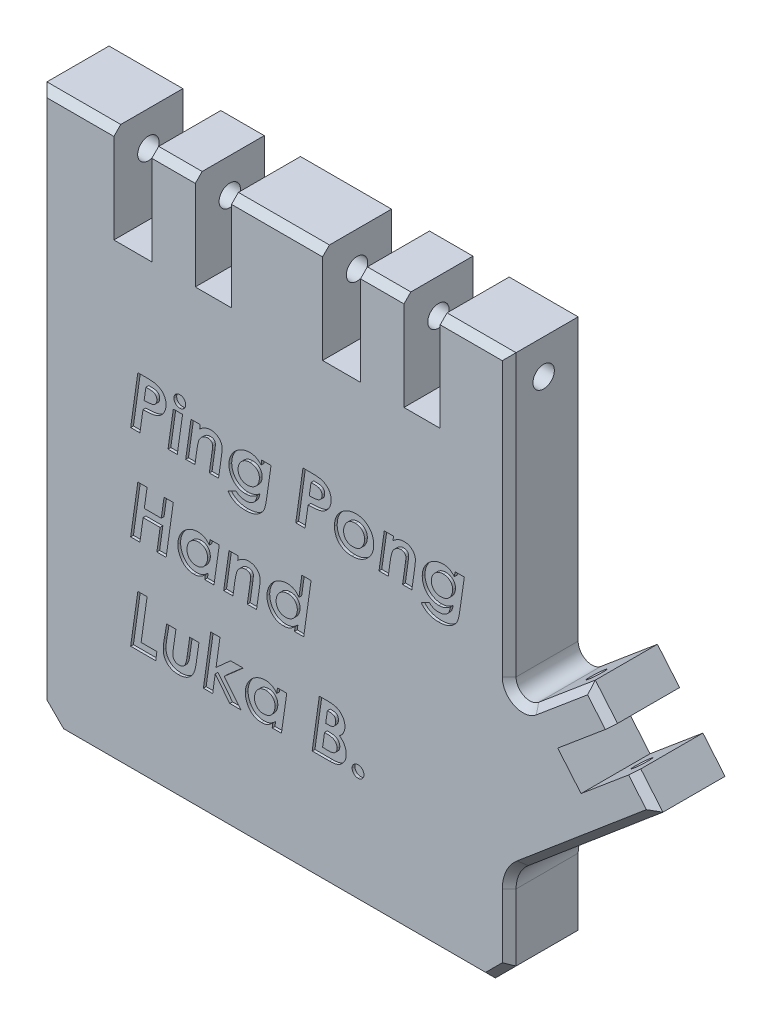
from build123d import *

# Parameters (mm, degrees)
ESQUISSE1_W                  = 68
ESQUISSE1_H                  = 80
BOSS_EXTRU_1_DEPTH           = 10
ESQUISSE2_W                  = 5.25
ESQUISSE2_H                  = 14
ENL_V_MAT_EXTRU_1_DEPTH      = 10
ESQUISSE3_R                  = 1.55
ENL_V_MAT_EXTRU_2_DEPTH      = 80.523581408
BOSS_EXTRU_3_DEPTH           = 10
ENL_V_MAT_EXTRU_6_DEPTH      = 10
ENL_V_MAT_EXTRU_6_DEPTH_BACK = 10
ESQUISSE9_R                  = 1.25
CONG_1_R                     = 2
CONG_2_R                     = 5
ESQUISSE11_W                 = 5.5
ESQUISSE11_H                 = 14
ENL_V_MAT_EXTRU_8_DEPTH      = 10
CHANFREIN1_SIZE              = 3
CHANFREIN2_SIZE              = 1
ENL_V_MAT_EXTRU_9_DEPTH      = 0.4


with BuildPart() as part:
    # Esquisse1 → Boss.-Extru.1 (new body)
    with BuildSketch(Plane.XY):
        Rectangle(ESQUISSE1_W, ESQUISSE1_H)
    extrude(amount=BOSS_EXTRU_1_DEPTH)

    # Esquisse2 → Enlèv. mat.-Extru.1 (cut)
    with BuildSketch(Plane.XY.offset(10)):
        with Locations((21.375, 33)):
            Rectangle(ESQUISSE2_W, ESQUISSE2_H)
        with Locations((-8.875, 33)):
            Rectangle(ESQUISSE2_W, ESQUISSE2_H)
    extrude(amount=-ENL_V_MAT_EXTRU_1_DEPTH, mode=Mode.SUBTRACT)

    # Esquisse3 → Enlèv. mat.-Extru.2 (cut, through all)
    with BuildSketch(Plane(origin=(34, 0, 0), x_dir=(0, 0, -1), z_dir=(1, 0, 0))):
        with Locations((-5, 35)):
            Circle(ESQUISSE3_R)
    extrude(amount=-ENL_V_MAT_EXTRU_2_DEPTH, mode=Mode.SUBTRACT)

    # Esquisse8 → Boss.-Extru.3 (add)
    with BuildSketch(Plane.XY.offset(10)):
        Polygon((34, -5), (45.490666647, 4.641814145), (48.704604695, 0.81159193), (41.044160264, -5.616284167), (44.418795215, -9.638017494), (52.079239646, -3.210141397), (55.293177695, -7.040363612), (34, -25), align=None)
    extrude(amount=-BOSS_EXTRU_3_DEPTH)

    # Esquisse9 → Enlèv. mat.-Extru.6 (cut, two sides: drawn at the far end of the back side and taken through both)
    with BuildSketch(Plane(origin=(19.723938411, -23.506074461, 0), x_dir=(0.7660444431189791, 0.642787609686538, 0), z_dir=(0.642787609686538, -0.7660444431189791, 0)).offset(-ENL_V_MAT_EXTRU_6_DEPTH_BACK)):
        with Locations((32.831573018, 5)):
            Circle(ESQUISSE9_R)
    extrude(amount=ENL_V_MAT_EXTRU_6_DEPTH + ENL_V_MAT_EXTRU_6_DEPTH_BACK, mode=Mode.SUBTRACT)

    # Congé1
    cong_1_edges = [part.edges().sort_by_distance(p)[0] for p in [
        (34, -5, 5),
    ]]
    fillet(cong_1_edges, radius=CONG_1_R)

    # Congé2
    cong_2_edges = [part.edges().sort_by_distance(p)[0] for p in [
        (34, -25, 5),
    ]]
    fillet(cong_2_edges, radius=CONG_2_R)

    # Esquisse11 → Enlèv. mat.-Extru.8 (cut)
    with BuildSketch(Plane.XY.offset(10)):
        with Locations((9.7, 33)):
            Rectangle(ESQUISSE11_W, ESQUISSE11_H)
        with Locations((-20.55, 33)):
            Rectangle(ESQUISSE11_W, ESQUISSE11_H)
    extrude(amount=-ENL_V_MAT_EXTRU_8_DEPTH, mode=Mode.SUBTRACT)

    # Chanfrein1
    chanfrein1_edges = [part.edges().sort_by_distance(p)[0] for p in [
        (-34, -40, 5),
        (34, -40, 5),
    ]]
    chamfer(chanfrein1_edges, length=CHANFREIN1_SIZE)

    # Chanfrein2
    chanfrein2_edges = [part.edges().sort_by_distance(p)[0] for p in [
        (-14.65, 40, 10),
        (0.35, 40, 10),
        (15.6, 40, 10),
        (53.68620867, -5.125252504, 10),
        (47.097635671, 2.726703038, 10),
        (41.388120933, 1.19936955, 10),
        (35.154763477, -2.523601733, 10),
        (29, 40, 10),
        (34, 19.644506921, 10),
        (45.534751361, -15.271065068, 10),
        (34.465775984, -25.2164738, 10),
        (-28.65, 40, 10),
        (34, -32.161898678, 10),
        (32.5, -38.5, 10),
        (0, -40, 10),
        (-32.5, -38.5, 10),
        (-34, 1.5, 10),
    ]]
    chamfer(chanfrein2_edges, length=CHANFREIN2_SIZE)

    # Esquisse12 → Enlèv. mat.-Extru.9 (cut)
    # profile 1 of 19: a face of its own
    with BuildSketch(Plane.XY.offset(10)):
        with BuildLine():
            Line((-19.82757662, 11.07862218), (-18.560205493, 11.07862218))
            add(Edge.make_bspline(
                [(-18.560205493, 11.07862218), (-18.467687623, 11.078245378), (-18.289513215, 11.077519718), (-18.032693238, 11.06664109), (-17.796577055, 11.050858367), (-17.581747529, 11.028755158), (-17.38824762, 11.00184741), (-17.216643959, 10.96531716), (-17.064775083, 10.926367713), (-16.973462522, 10.889564385), (-16.93072833, 10.872340462)],
                knots=[0, 0, 0, 0, 1.344208059, 2.588726621, 3.734329264, 4.782131975, 5.726482068, 6.570895881, 7.331180631, 8, 8, 8, 8], degree=3))
            add(Edge.make_bspline(
                [(-16.93072833, 10.872340462), (-16.882904705, 10.850761862), (-16.788641001, 10.808228934), (-16.655455398, 10.733827123), (-16.531462538, 10.652893047), (-16.415497628, 10.56721487), (-16.308409175, 10.474911647), (-16.209574154, 10.376726338), (-16.120759502, 10.271064467), (-16.040207514, 10.159543913), (-15.969330688, 10.042144888), (-15.906356271, 9.920556192), (-15.854821437, 9.793596232), (-15.810907236, 9.662522419), (-15.778763264, 9.52527797), (-15.755456161, 9.383468754), (-15.739560795, 9.236790014), (-15.738234232, 9.137539169), (-15.737559259, 9.08703898)],
                knots=[0, 0, 0, 0, 1.101151138, 2.170445781, 3.198860437, 4.208379212, 5.195204417, 6.164605257, 7.130047863, 8.089887807, 9.049952485, 10.006809717, 10.961522665, 11.923831799, 12.906274987, 13.917075149, 14.940179313, 16, 16, 16, 16], degree=3))
            add(Edge.make_bspline(
                [(-15.737559259, 9.08703898), (-15.738828072, 9.03159959), (-15.741348457, 8.921474094), (-15.757556691, 8.758694942), (-15.785884654, 8.599915791), (-15.826584433, 8.445460773), (-15.876333801, 8.293713322), (-15.939425779, 8.146834017), (-16.011848144, 8.00345485), (-16.096967987, 7.866381034), (-16.189105398, 7.734285831), (-16.292346946, 7.612507438), (-16.402367049, 7.499956925), (-16.518585515, 7.394170457), (-16.644919248, 7.300623171), (-16.776941032, 7.213433387), (-16.917783203, 7.137765924), (-17.068076703, 7.069583561), (-17.235921476, 7.010796133), (-17.425428348, 6.959699806), (-17.640520198, 6.915361717), (-17.880342066, 6.879150023), (-18.145690919, 6.849483112), (-18.435824077, 6.82838227), (-18.751472173, 6.811309271), (-18.970271827, 6.806884889), (-19.084072013, 6.804583718)],
                knots=[0, 0, 0, 0, 0.866399648, 1.721027061, 2.553550129, 3.384204618, 4.21539855, 5.04677222, 5.880012857, 6.723270778, 7.566245156, 8.394738354, 9.214784533, 10.025005932, 10.847562629, 11.668810448, 12.495570546, 13.343317016, 14.245569203, 15.271435576, 16.408570332, 17.675782105, 19.060520395, 20.580184572, 22.221315141, 24, 24, 24, 24], degree=3))
            Line((-19.084072013, 6.804583718), (-19.524832229, 3.670288847))
            Line((-19.524832229, 3.670288847), (-20.866405413, 3.670288847))
            Line((-20.866405413, 3.670288847), (-19.82757662, 11.07862218))
        make_face()
        with BuildLine():
            add(Edge.make_bspline(
                [(-18.911923241, 8.039305941), (-18.82039973, 8.040862096), (-18.646182281, 8.043824278), (-18.39707783, 8.054632766), (-18.172820626, 8.075549566), (-17.972992515, 8.102626363), (-17.797984636, 8.13822131), (-17.647194924, 8.179611448), (-17.521870151, 8.231456056), (-17.418109785, 8.28989194), (-17.335770018, 8.3594718), (-17.262792427, 8.432410476), (-17.201771731, 8.51435607), (-17.152738948, 8.604571881), (-17.113523806, 8.701497735), (-17.087308874, 8.806919619), (-17.070817719, 8.919317434), (-17.068462535, 8.996947928), (-17.067260114, 9.036581582)],
                knots=[0, 0, 0, 0, 1.839895187, 3.502289619, 5.0101303, 6.365671836, 7.553232357, 8.598057788, 9.502875839, 10.27370316, 10.980290013, 11.662314044, 12.34441055, 13.025273935, 13.721358838, 14.440015487, 15.203561875, 16, 16, 16, 16], degree=3))
            add(Edge.make_bspline(
                [(-17.067260114, 9.036581582), (-17.069060806, 9.080707667), (-17.072571774, 9.166744214), (-17.097085525, 9.290443476), (-17.141735338, 9.402623506), (-17.200478073, 9.504354453), (-17.277678309, 9.593200114), (-17.370920298, 9.668402761), (-17.481177615, 9.728007266), (-17.586056569, 9.7647455), (-17.683500898, 9.788195159), (-17.774916547, 9.802083444), (-17.882241698, 9.815646862), (-18.006087924, 9.825225485), (-18.145556318, 9.834544673), (-18.301940546, 9.84018801), (-18.474616945, 9.842715278), (-18.595327053, 9.843494435), (-18.658152208, 9.843899958)],
                knots=[0, 0, 0, 0, 1.03742853, 2.022766538, 2.947121861, 3.864647693, 4.771646501, 5.697975149, 6.666071958, 7.703435297, 8.301453266, 9.020359131, 9.87578453, 10.844509861, 11.939964187, 13.162010635, 14.522931311, 16, 16, 16, 16], degree=3))
            Line((-18.658152208, 9.843899958), (-18.911923241, 8.039305941))
        make_face(mode=Mode.SUBTRACT)
    # profile 2 of 19: a face of its own
    with BuildSketch(Plane.XY.offset(10)):
        with BuildLine():
            add(Edge.make_bspline(
                [(-13.743007977, 11.363558077), (-13.686335319, 11.36025337), (-13.575013584, 11.353761956), (-13.413581633, 11.307127506), (-13.267848856, 11.223715392), (-13.136680213, 11.115078149), (-13.02804297, 10.983909506), (-12.944630856, 10.838176729), (-12.897996406, 10.676744778), (-12.891504992, 10.565423043), (-12.888200285, 10.508750385)],
                knots=[0, 0, 0, 0, 1.014134371, 1.992057583, 2.975098753, 4, 5.024901247, 6.007942417, 6.985865629, 8, 8, 8, 8], degree=3))
            add(Edge.make_bspline(
                [(-12.888200285, 10.508750385), (-12.891482459, 10.452064922), (-12.897929612, 10.340718033), (-12.945009758, 10.179050058), (-13.027530535, 10.032291791), (-13.136807285, 9.901093539), (-13.267400594, 9.791997875), (-13.414036372, 9.710703128), (-13.57495552, 9.663635329), (-13.686315731, 9.657212489), (-13.743007977, 9.653942693)],
                knots=[0, 0, 0, 0, 1.013694729, 1.991193998, 2.981551723, 4.006008661, 5.030465598, 6.008806002, 6.986305271, 8, 8, 8, 8], degree=3))
            add(Edge.make_bspline(
                [(-13.743007977, 9.653942693), (-13.799712732, 9.657190125), (-13.911097514, 9.663569034), (-14.072258296, 9.711081485), (-14.219909979, 9.79148589), (-14.350539458, 9.901218904), (-14.460272472, 10.031848383), (-14.540676878, 10.179500066), (-14.588189328, 10.340660848), (-14.594568237, 10.45204563), (-14.597815669, 10.508750385)],
                knots=[0, 0, 0, 0, 1.01324697, 1.990314468, 2.975995575, 4, 5.024004425, 6.009685532, 6.98675303, 8, 8, 8, 8], degree=3))
            add(Edge.make_bspline(
                [(-14.597815669, 10.508750385), (-14.594545873, 10.565442631), (-14.588123033, 10.676802842), (-14.541055234, 10.83772199), (-14.459760487, 10.984357768), (-14.350664824, 11.114951077), (-14.219466571, 11.224227827), (-14.072708305, 11.306748604), (-13.911040329, 11.35382875), (-13.79969344, 11.360275903), (-13.743007977, 11.363558077)],
                knots=[0, 0, 0, 0, 1.013694729, 1.991193998, 2.969534402, 3.993991339, 5.018448277, 6.008806002, 6.986305271, 8, 8, 8, 8], degree=3))
        make_face()
    # profile 3 of 19: a face of its own
    with BuildSketch(Plane.XY.offset(10)):
        Polygon((-14.683890055, 9.084070898), (-13.342316871, 9.084070898), (-14.111050178, 3.670288847), (-15.452623362, 3.670288847), align=None)
    # profile 4 of 19: a face of its own
    with BuildSketch(Plane.XY.offset(10)):
        with BuildLine():
            Line((-12.119466978, 9.084070898), (-10.777893794, 9.084070898))
            Line((-10.777893794, 9.084070898), (-10.862484139, 8.486002321))
            add(Edge.make_bspline(
                [(-10.862484139, 8.486002321), (-10.797976679, 8.540925332), (-10.671879455, 8.648287166), (-10.473479991, 8.789010027), (-10.274916111, 8.911297354), (-10.072118328, 9.006953007), (-9.868511645, 9.084469326), (-9.662660961, 9.138933157), (-9.454307151, 9.17346973), (-9.314761751, 9.177187648), (-9.244879304, 9.17904953)],
                knots=[0, 0, 0, 0, 1.129074261, 2.207080079, 3.239806547, 4.233987332, 5.191979582, 6.140686111, 7.068880775, 8, 8, 8, 8], degree=3))
            add(Edge.make_bspline(
                [(-9.244879304, 9.17904953), (-9.18646618, 9.177388754), (-9.071796587, 9.174128519), (-8.903692886, 9.155499747), (-8.744368097, 9.120908808), (-8.592821065, 9.073800957), (-8.450512046, 9.010302068), (-8.314035733, 8.936942111), (-8.187711218, 8.846399256), (-8.06937899, 8.745123514), (-7.963549077, 8.632358804), (-7.86866528, 8.513650813), (-7.789923228, 8.386222713), (-7.723917422, 8.252332086), (-7.673340409, 8.110381479), (-7.637938351, 7.961593573), (-7.616858653, 7.80592525), (-7.613927984, 7.700020572), (-7.612434059, 7.64603504)],
                knots=[0, 0, 0, 0, 1.118022855, 2.194767494, 3.230795032, 4.233728951, 5.225657328, 6.208555818, 7.193457995, 8.193528683, 9.184553253, 10.148487881, 11.096723343, 12.045053303, 13.000209424, 13.973718189, 14.967090947, 16, 16, 16, 16], degree=3))
            add(Edge.make_bspline(
                [(-7.612434059, 7.64603504), (-7.614034917, 7.587647798), (-7.617579418, 7.458371054), (-7.63263694, 7.244865879), (-7.662457032, 6.9938037), (-7.68594742, 6.813460357), (-7.698508444, 6.717025292)],
                knots=[0, 0, 0, 0, 0.750743129, 1.6622403, 2.749928862, 4, 4, 4, 4], degree=3))
            Line((-7.698508444, 6.717025292), (-8.127396332, 3.670288847))
            Line((-8.127396332, 3.670288847), (-9.468969515, 3.670288847))
            Line((-9.468969515, 3.670288847), (-9.048985875, 6.650243441))
            add(Edge.make_bspline(
                [(-9.048985875, 6.650243441), (-9.039824991, 6.717980486), (-9.022727708, 6.844400524), (-9.002708623, 7.020458119), (-8.992130853, 7.169536043), (-8.989378879, 7.259679143), (-8.988140189, 7.300253457)],
                knots=[0, 0, 0, 0, 1.255630561, 2.343427635, 3.254360171, 4, 4, 4, 4], degree=3))
            add(Edge.make_bspline(
                [(-8.988140189, 7.300253457), (-8.990251133, 7.348945691), (-8.994299633, 7.442330661), (-9.02968052, 7.574196413), (-9.092249135, 7.687446155), (-9.178732988, 7.780953584), (-9.286948489, 7.85472132), (-9.415396745, 7.908573517), (-9.565010444, 7.939140048), (-9.671149617, 7.942534819), (-9.727192673, 7.944327308)],
                knots=[0, 0, 0, 0, 1.048265012, 2.010427263, 2.912347805, 3.810226671, 4.72992967, 5.714049657, 6.792984344, 8, 8, 8, 8], degree=3))
            add(Edge.make_bspline(
                [(-9.727192673, 7.944327308), (-9.784784962, 7.941123475), (-9.901404637, 7.934635976), (-10.076362053, 7.891791773), (-10.248809303, 7.816572604), (-10.419688721, 7.718505829), (-10.581558693, 7.594822086), (-10.724229515, 7.444658701), (-10.848824357, 7.274026077), (-10.935059944, 7.112165372), (-10.995136158, 6.963875741), (-11.039681579, 6.829040578), (-11.081583762, 6.671635153), (-11.124771868, 6.4926325), (-11.165839718, 6.291015585), (-11.207300293, 6.067949111), (-11.24754375, 5.822057805), (-11.271459093, 5.650548869), (-11.283951821, 5.560957249)],
                knots=[0, 0, 0, 0, 0.882065441, 1.786110384, 2.740104157, 3.754965612, 4.797500545, 5.847687264, 6.91599857, 8.024311006, 8.646136181, 9.364850473, 10.197408591, 11.140054438, 12.184569392, 13.348033438, 14.614684545, 16, 16, 16, 16], degree=3))
            Line((-11.283951821, 5.560957249), (-11.546627101, 3.670288847))
            Line((-11.546627101, 3.670288847), (-12.888200285, 3.670288847))
            Line((-12.888200285, 3.670288847), (-12.119466978, 9.084070898))
        make_face()
    # profile 5 of 19: a face of its own
    with BuildSketch(Plane.XY.offset(10)):
        with BuildLine():
            Line((-1.86177467, 9.084070898), (-0.520201487, 9.084070898))
            Line((-0.520201487, 9.084070898), (-1.139046639, 4.743250585))
            add(Edge.make_bspline(
                [(-1.139046639, 4.743250585), (-1.15360985, 4.641800592), (-1.181416223, 4.448096307), (-1.225648558, 4.170893952), (-1.27173774, 3.920637801), (-1.317035921, 3.696824866), (-1.36335441, 3.499926214), (-1.408025766, 3.329603248), (-1.455088137, 3.18579217), (-1.490773474, 3.100724837), (-1.50708884, 3.061831982)],
                knots=[0, 0, 0, 0, 1.425557641, 2.721898884, 3.90413036, 4.964777991, 5.897734604, 6.717254701, 7.413527788, 8, 8, 8, 8], degree=3))
            add(Edge.make_bspline(
                [(-1.50708884, 3.061831982), (-1.532989424, 3.009449506), (-1.584887023, 2.90448953), (-1.677906318, 2.75421065), (-1.782580948, 2.609934223), (-1.90281739, 2.474840282), (-2.033696352, 2.345485045), (-2.176329744, 2.22166772), (-2.332860268, 2.106031037), (-2.50149018, 1.997646376), (-2.682609005, 1.900101932), (-2.873955146, 1.813164365), (-3.07754206, 1.742584375), (-3.291497819, 1.682803721), (-3.517220257, 1.637126993), (-3.754215854, 1.605290779), (-4.00183892, 1.583175118), (-4.170892094, 1.581574417), (-4.257017058, 1.580758932)],
                knots=[0, 0, 0, 0, 0.848722765, 1.700605388, 2.564683116, 3.435640102, 4.325146403, 5.237365694, 6.177589408, 7.150652229, 8.147712522, 9.164401618, 10.201095546, 11.275385682, 12.390480559, 13.544289662, 14.748926394, 16, 16, 16, 16], degree=3))
            add(Edge.make_bspline(
                [(-4.257017058, 1.580758932), (-4.328784561, 1.581313487), (-4.470536845, 1.582408821), (-4.679439221, 1.600111603), (-4.881682592, 1.624433346), (-5.076435011, 1.660159599), (-5.264297121, 1.706154218), (-5.444911791, 1.762886094), (-5.619704589, 1.827317293), (-5.784931623, 1.905144908), (-5.941912324, 1.989442211), (-6.089857881, 2.079589088), (-6.225787136, 2.178597383), (-6.354282073, 2.279743906), (-6.470248503, 2.389540281), (-6.577619899, 2.502952084), (-6.673181419, 2.624186966), (-6.729508097, 2.709219272), (-6.757626366, 2.751667386)],
                knots=[0, 0, 0, 0, 1.195376191, 2.361058964, 3.490722906, 4.588423122, 5.657911385, 6.711109717, 7.741385947, 8.759157032, 9.751137033, 10.709575272, 11.642803097, 12.551579152, 13.432107972, 14.300987019, 15.151852979, 16, 16, 16, 16], degree=3))
            Line((-6.757626366, 2.751667386), (-5.589685995, 3.342315756))
            add(Edge.make_bspline(
                [(-5.589685995, 3.342315756), (-5.545012026, 3.300279358), (-5.456493809, 3.216987296), (-5.309465893, 3.109713371), (-5.152852309, 3.018591583), (-4.985632105, 2.944094272), (-4.808479191, 2.886511679), (-4.621780914, 2.844397777), (-4.425298297, 2.821210312), (-4.291206958, 2.817414973), (-4.222884112, 2.815481154)],
                knots=[0, 0, 0, 0, 0.977550395, 1.936944955, 2.894976139, 3.862639267, 4.850608126, 5.861218119, 6.91023786, 8, 8, 8, 8], degree=3))
            add(Edge.make_bspline(
                [(-4.222884112, 2.815481154), (-4.144105112, 2.817231626), (-3.990773605, 2.820638657), (-3.769868275, 2.853890776), (-3.564749583, 2.906793772), (-3.37795351, 2.983112602), (-3.207832628, 3.075799803), (-3.058692911, 3.186919598), (-2.927357241, 3.310961985), (-2.814193612, 3.453898589), (-2.720201654, 3.624198322), (-2.645238434, 3.826684604), (-2.58043176, 4.062350403), (-2.55399695, 4.232862874), (-2.539981468, 4.323266945)],
                knots=[0, 0, 0, 0, 1.122608778, 2.184989621, 3.177318613, 4.136115396, 5.054845127, 5.932331134, 6.780466063, 7.624307801, 8.521114189, 9.541548559, 10.696552705, 12, 12, 12, 12], degree=3))
            add(Edge.make_bspline(
                [(-2.539981468, 4.323266945), (-2.601914778, 4.271161645), (-2.723832847, 4.168590386), (-2.920132473, 4.036270245), (-3.121549178, 3.923295166), (-3.329412068, 3.830114819), (-3.543733656, 3.75868103), (-3.764510912, 3.708787181), (-3.990891109, 3.676020183), (-4.144116157, 3.672210421), (-4.221400071, 3.670288847)],
                knots=[0, 0, 0, 0, 1.052295004, 2.071482604, 3.074078288, 4.053543919, 5.030363342, 6.00760664, 6.995073198, 8, 8, 8, 8], degree=3))
            add(Edge.make_bspline(
                [(-4.221400071, 3.670288847), (-4.328583138, 3.673575351), (-4.540775557, 3.680081709), (-4.851462419, 3.74493322), (-5.151439063, 3.841410974), (-5.433983976, 3.982385084), (-5.69783538, 4.156067719), (-5.931493402, 4.367752197), (-6.138002051, 4.609245017), (-6.310225546, 4.88202375), (-6.448264596, 5.178882969), (-6.547901243, 5.493987159), (-6.609484767, 5.825681925), (-6.616192457, 6.052399837), (-6.619610541, 6.167930073)],
                knots=[0, 0, 0, 0, 0.99681879, 1.973421704, 2.943604368, 3.924240518, 4.90418396, 5.876267682, 6.850096227, 7.854549524, 8.870597656, 9.890408615, 10.925000736, 12, 12, 12, 12], degree=3))
            add(Edge.make_bspline(
                [(-6.619610541, 6.167930073), (-6.618804539, 6.233795663), (-6.617200494, 6.364876323), (-6.593993492, 6.55935611), (-6.564775018, 6.75177141), (-6.517450523, 6.93974322), (-6.460124527, 7.125730496), (-6.386449897, 7.30677744), (-6.30363202, 7.487119313), (-6.205395873, 7.661732481), (-6.098606917, 7.832424671), (-5.978219689, 7.992612747), (-5.851811745, 8.146509175), (-5.712146732, 8.287985632), (-5.56759925, 8.424638767), (-5.410697773, 8.548639524), (-5.245663228, 8.665337796), (-5.071431643, 8.770614456), (-4.892751045, 8.867553881), (-4.710144669, 8.950541315), (-4.5251093, 9.020468601), (-4.338450792, 9.078769099), (-4.149339334, 9.122908234), (-3.958682759, 9.156109997), (-3.765729333, 9.175911075), (-3.636237876, 9.178002279), (-3.571390055, 9.17904953)],
                knots=[0, 0, 0, 0, 0.998960082, 1.98805393, 2.969281014, 3.950737841, 4.926637061, 5.920647915, 6.914828865, 7.93643968, 8.959070659, 9.968107751, 10.975495655, 11.978959383, 12.982984647, 13.992496429, 15.011012954, 16.0487989, 17.079992203, 18.094627595, 19.090196572, 20.08042947, 21.060133154, 22.035194556, 23.016048195, 24, 24, 24, 24], degree=3))
            add(Edge.make_bspline(
                [(-3.571390055, 9.17904953), (-3.494576605, 9.177368899), (-3.343124664, 9.174055224), (-3.122354917, 9.138550554), (-2.911777662, 9.083649199), (-2.710592082, 9.005991097), (-2.515783055, 8.901315392), (-2.32492942, 8.767566431), (-2.136445485, 8.603920881), (-2.018948334, 8.478229349), (-1.958237344, 8.413284306)],
                knots=[0, 0, 0, 0, 0.997558012, 1.966870372, 2.897877257, 3.821999006, 4.762569202, 5.764901779, 6.845120699, 8, 8, 8, 8], degree=3))
            Line((-1.958237344, 8.413284306), (-1.86177467, 9.084070898))
        make_face()
        with BuildLine():
            add(Edge.make_bspline(
                [(-3.56545389, 7.944327308), (-3.624908947, 7.943114061), (-3.741840719, 7.940727936), (-3.9136009, 7.915509791), (-4.078557395, 7.878125532), (-4.236078399, 7.822182361), (-4.386159902, 7.750865886), (-4.529341378, 7.663723136), (-4.66670259, 7.563302638), (-4.793221595, 7.445594322), (-4.909397057, 7.318365723), (-5.011683657, 7.181916268), (-5.097723392, 7.038161896), (-5.167838658, 6.886809803), (-5.223510865, 6.728954039), (-5.261117911, 6.563573299), (-5.286375045, 6.391313863), (-5.288715046, 6.273885846), (-5.289909686, 6.213935348)],
                knots=[0, 0, 0, 0, 1.046811451, 2.058790701, 3.052437673, 4.022760614, 4.99741895, 5.974995723, 6.972115194, 7.989932835, 9.014186185, 10.004310117, 10.989357247, 11.960306304, 12.938853955, 13.932500926, 14.944480177, 16, 16, 16, 16], degree=3))
            add(Edge.make_bspline(
                [(-5.289909686, 6.213935348), (-5.288910101, 6.165382416), (-5.286964968, 6.070901325), (-5.267732638, 5.933095576), (-5.241390701, 5.802168536), (-5.198090005, 5.679612478), (-5.146925834, 5.563119669), (-5.082780195, 5.454834803), (-5.0074608, 5.353571613), (-4.920599723, 5.261262687), (-4.823732042, 5.177475637), (-4.718120262, 5.105446082), (-4.606105042, 5.041754852), (-4.484971745, 4.991230761), (-4.355820221, 4.953570152), (-4.219513995, 4.924580833), (-4.07535109, 4.908698819), (-3.976569122, 4.906258473), (-3.926075886, 4.905011069)],
                knots=[0, 0, 0, 0, 1.092070465, 2.125103607, 3.127500323, 4.092273583, 5.044175292, 5.987507913, 6.9183385, 7.879378053, 8.834659921, 9.795183341, 10.75228035, 11.730389622, 12.741406616, 13.776477892, 14.863427915, 16, 16, 16, 16], degree=3))
            add(Edge.make_bspline(
                [(-3.926075886, 4.905011069), (-3.849649189, 4.907170018), (-3.698504197, 4.911439656), (-3.477243329, 4.957966422), (-3.263128125, 5.024388588), (-3.061040932, 5.123875371), (-2.873222207, 5.24715199), (-2.704401103, 5.396609346), (-2.556565324, 5.569634146), (-2.433189049, 5.765902707), (-2.33229704, 5.976900829), (-2.259177611, 6.199206359), (-2.214803236, 6.429833727), (-2.208998518, 6.586236993), (-2.206072213, 6.665083852)],
                knots=[0, 0, 0, 0, 1.001494803, 1.980602726, 2.955828708, 3.937236953, 4.925769891, 5.896230192, 6.886296863, 7.902061996, 8.930056387, 9.948349488, 10.965710873, 12, 12, 12, 12], degree=3))
            add(Edge.make_bspline(
                [(-2.206072213, 6.665083852), (-2.207165562, 6.710161347), (-2.209313079, 6.798700961), (-2.227622414, 6.928438373), (-2.257114187, 7.052314833), (-2.29898888, 7.170161159), (-2.352335791, 7.282653221), (-2.420055211, 7.387649448), (-2.497389321, 7.488065565), (-2.586678584, 7.581262197), (-2.684863431, 7.666474493), (-2.790677489, 7.741278049), (-2.903327727, 7.803789028), (-3.021990516, 7.856940736), (-3.149296303, 7.893716307), (-3.281665812, 7.92517437), (-3.421641089, 7.940460362), (-3.516949196, 7.943023078), (-3.56545389, 7.944327308)],
                knots=[0, 0, 0, 0, 1.034550982, 2.032028274, 3.001701328, 3.953652157, 4.898530243, 5.853254966, 6.8165213, 7.804643382, 8.811132656, 9.797425365, 10.773727379, 11.765498085, 12.775058661, 13.81110484, 14.886016167, 16, 16, 16, 16], degree=3))
        make_face(mode=Mode.SUBTRACT)
    # profile 6 of 19: a face of its own
    with BuildSketch(Plane.XY.offset(10)):
        with BuildLine():
            Line((4.107038764, 11.07862218), (5.374409892, 11.07862218))
            add(Edge.make_bspline(
                [(5.374409892, 11.07862218), (5.466927762, 11.078245378), (5.645102169, 11.077519718), (5.901922147, 11.06664109), (6.13803833, 11.050858367), (6.352867856, 11.028755158), (6.546367765, 11.00184741), (6.717971426, 10.96531716), (6.869840302, 10.926367713), (6.961152863, 10.889564385), (7.003887055, 10.872340462)],
                knots=[0, 0, 0, 0, 1.344208059, 2.588726621, 3.734329264, 4.782131975, 5.726482068, 6.570895881, 7.331180631, 8, 8, 8, 8], degree=3))
            add(Edge.make_bspline(
                [(7.003887055, 10.872340462), (7.05171068, 10.850761862), (7.145974383, 10.808228934), (7.279159987, 10.733827123), (7.403152846, 10.652893047), (7.519117757, 10.56721487), (7.62620621, 10.474911647), (7.72504123, 10.376726338), (7.813855882, 10.271064467), (7.894407871, 10.159543913), (7.965284697, 10.042144888), (8.028259114, 9.920556192), (8.079793948, 9.793596232), (8.123708149, 9.662522419), (8.155852121, 9.52527797), (8.179159224, 9.383468754), (8.19505459, 9.236790014), (8.196381152, 9.137539169), (8.197056126, 9.08703898)],
                knots=[0, 0, 0, 0, 1.101151138, 2.170445781, 3.198860437, 4.208379212, 5.195204417, 6.164605257, 7.130047863, 8.089887807, 9.049952485, 10.006809717, 10.961522665, 11.923831799, 12.906274987, 13.917075149, 14.940179313, 16, 16, 16, 16], degree=3))
            add(Edge.make_bspline(
                [(8.197056126, 9.08703898), (8.195787313, 9.03159959), (8.193266927, 8.921474094), (8.177058693, 8.758694942), (8.148730731, 8.599915791), (8.108030952, 8.445460773), (8.058281584, 8.293713322), (7.995189605, 8.146834017), (7.922767241, 8.00345485), (7.837647397, 7.866381034), (7.745509987, 7.734285831), (7.642268439, 7.612507438), (7.532248336, 7.499956925), (7.41602987, 7.394170457), (7.289696136, 7.300623171), (7.157674352, 7.213433387), (7.016832182, 7.137765924), (6.866538682, 7.069583561), (6.698693909, 7.010796133), (6.509187037, 6.959699806), (6.294095187, 6.915361717), (6.054273318, 6.879150023), (5.788924466, 6.849483112), (5.498791307, 6.82838227), (5.183143212, 6.811309271), (4.964343558, 6.806884889), (4.850543372, 6.804583718)],
                knots=[0, 0, 0, 0, 0.866399648, 1.721027061, 2.553550129, 3.384204618, 4.21539855, 5.04677222, 5.880012857, 6.723270778, 7.566245156, 8.394738354, 9.214784533, 10.025005932, 10.847562629, 11.668810448, 12.495570546, 13.343317016, 14.245569203, 15.271435576, 16.408570332, 17.675782105, 19.060520395, 20.580184572, 22.221315141, 24, 24, 24, 24], degree=3))
            Line((4.850543372, 6.804583718), (4.409783155, 3.670288847))
            Line((4.409783155, 3.670288847), (3.068209972, 3.670288847))
            Line((3.068209972, 3.670288847), (4.107038764, 11.07862218))
        make_face()
        with BuildLine():
            add(Edge.make_bspline(
                [(5.022692143, 8.039305941), (5.114215655, 8.040862096), (5.288433103, 8.043824278), (5.537537555, 8.054632766), (5.761794759, 8.075549566), (5.961622869, 8.102626363), (6.136630749, 8.13822131), (6.287420461, 8.179611448), (6.412745233, 8.231456056), (6.516505599, 8.28989194), (6.598845366, 8.3594718), (6.671822958, 8.432410476), (6.732843653, 8.51435607), (6.781876437, 8.604571881), (6.821091579, 8.701497735), (6.847306511, 8.806919619), (6.863797665, 8.919317434), (6.86615285, 8.996947928), (6.867355271, 9.036581582)],
                knots=[0, 0, 0, 0, 1.839895187, 3.502289619, 5.0101303, 6.365671836, 7.553232357, 8.598057788, 9.502875839, 10.27370316, 10.980290013, 11.662314044, 12.34441055, 13.025273935, 13.721358838, 14.440015487, 15.203561875, 16, 16, 16, 16], degree=3))
            add(Edge.make_bspline(
                [(6.867355271, 9.036581582), (6.865554579, 9.080707667), (6.86204361, 9.166744214), (6.83752986, 9.290443476), (6.792880046, 9.402623506), (6.734137311, 9.504354453), (6.656937076, 9.593200114), (6.563695087, 9.668402761), (6.45343777, 9.728007266), (6.348558816, 9.7647455), (6.251114487, 9.788195159), (6.159698838, 9.802083444), (6.052373686, 9.815646862), (5.928527461, 9.825225485), (5.789059067, 9.834544673), (5.632674838, 9.84018801), (5.45999844, 9.842715278), (5.339288332, 9.843494435), (5.276463177, 9.843899958)],
                knots=[0, 0, 0, 0, 1.03742853, 2.022766538, 2.947121861, 3.864647693, 4.771646501, 5.697975149, 6.666071958, 7.703435297, 8.301453266, 9.020359131, 9.87578453, 10.844509861, 11.939964187, 13.162010635, 14.522931311, 16, 16, 16, 16], degree=3))
            Line((5.276463177, 9.843899958), (5.022692143, 8.039305941))
        make_face(mode=Mode.SUBTRACT)
    # profile 7 of 19: a face of its own
    with BuildSketch(Plane.XY.offset(10)):
        with BuildLine():
            add(Edge.make_bspline(
                [(11.794371831, 9.17904953), (11.854275182, 9.178497375), (11.972831931, 9.177404584), (12.148589241, 9.159467107), (12.320694802, 9.135143207), (12.488321904, 9.099574911), (12.651322402, 9.053102721), (12.810386346, 8.99649275), (12.965906848, 8.930315008), (13.115732124, 8.852665101), (13.259730363, 8.766849021), (13.396581931, 8.672204635), (13.524007704, 8.567366992), (13.645580839, 8.456425381), (13.756179748, 8.334348693), (13.858810972, 8.204612165), (13.954715099, 8.067289153), (14.041633021, 7.921533645), (14.118175441, 7.768238107), (14.187297479, 7.611336342), (14.243775348, 7.448410347), (14.288753388, 7.28101459), (14.327500284, 7.109528449), (14.350896761, 6.933173909), (14.369115237, 6.75252555), (14.370144979, 6.630506171), (14.370667237, 6.568621178)],
                knots=[0, 0, 0, 0, 1.048380346, 2.074885017, 3.090367486, 4.090964834, 5.072523792, 6.056029873, 7.045505985, 8.029469653, 9.008388104, 9.979110116, 10.939576094, 11.895736256, 12.858269977, 13.820062943, 14.790784955, 15.789017664, 16.788414625, 17.789274365, 18.789121639, 19.804049856, 20.823403653, 21.864603227, 22.916983403, 24, 24, 24, 24], degree=3))
            add(Edge.make_bspline(
                [(14.370667237, 6.568621178), (14.367634657, 6.466584771), (14.36166173, 6.26561525), (14.319782604, 5.969973482), (14.248208189, 5.686557664), (14.148007258, 5.41454789), (14.019834605, 5.153873108), (13.863158166, 4.904299714), (13.676149244, 4.668428242), (13.465297637, 4.445711828), (13.233929514, 4.241685637), (12.985842432, 4.063223166), (12.724221383, 3.912358945), (12.449718634, 3.787887242), (12.160333278, 3.693271804), (11.858211091, 3.625505478), (11.542844749, 3.582144727), (11.328032303, 3.57761736), (11.218563871, 3.575310214)],
                knots=[0, 0, 0, 0, 1.011104245, 1.991457176, 2.952197104, 3.902991464, 4.858928698, 5.826026836, 6.817568841, 7.837123857, 8.861887107, 9.870051414, 10.860623363, 11.850212162, 12.851715058, 13.872153699, 14.915649431, 16, 16, 16, 16], degree=3))
            add(Edge.make_bspline(
                [(11.218563871, 3.575310214), (11.123972121, 3.577051179), (10.939141927, 3.580452985), (10.669639055, 3.614396267), (10.414402833, 3.666630882), (10.174138311, 3.74328952), (9.947888696, 3.839070697), (9.736578071, 3.95773659), (9.539668382, 4.097072875), (9.361159381, 4.259561035), (9.198660852, 4.43726155), (9.05780943, 4.630602713), (8.937343084, 4.837035638), (8.841634076, 5.057705573), (8.765375217, 5.290690989), (8.710621145, 5.536612641), (8.677265857, 5.79599749), (8.673746829, 5.97341911), (8.671949288, 6.064047193)],
                knots=[0, 0, 0, 0, 1.130534475, 2.209039425, 3.242686211, 4.241648197, 5.219495055, 6.175504508, 7.134035888, 8.097337106, 9.056251676, 10.008649417, 10.952170628, 11.908308165, 12.879116703, 13.879338768, 14.916752852, 16, 16, 16, 16], degree=3))
            add(Edge.make_bspline(
                [(8.671949288, 6.064047193), (8.674880384, 6.173501927), (8.680646494, 6.388823449), (8.723761804, 6.704866136), (8.798455786, 7.006009799), (8.901630391, 7.292793261), (9.031924264, 7.566567074), (9.195932926, 7.823859053), (9.386223382, 8.068862306), (9.605222205, 8.294824763), (9.842352264, 8.500956865), (10.091251331, 8.683299793), (10.352189841, 8.834963583), (10.62079803, 8.963055035), (10.901597206, 9.058757663), (11.190529982, 9.129032599), (11.489348454, 9.171938315), (11.691832122, 9.176658953), (11.794371831, 9.17904953)],
                knots=[0, 0, 0, 0, 1.070407058, 2.105725986, 3.11260329, 4.099768105, 5.082273654, 6.071629737, 7.078227986, 8.111679688, 9.144009435, 10.148605521, 11.124500349, 12.092034995, 13.054511379, 14.020338642, 14.997480131, 16, 16, 16, 16], degree=3))
        make_face()
        with BuildLine():
            add(Edge.make_bspline(
                [(11.696425116, 7.944327308), (11.630044572, 7.942712904), (11.500675914, 7.9395666), (11.31261304, 7.912346304), (11.136390185, 7.868002767), (10.971345348, 7.805922672), (10.819677287, 7.723095688), (10.678047508, 7.624887464), (10.550568964, 7.506434021), (10.435699596, 7.373271155), (10.334447179, 7.2296754), (10.245463848, 7.081943822), (10.170148494, 6.930671832), (10.110277173, 6.776242081), (10.059667092, 6.619664453), (10.026039765, 6.459500927), (10.006542101, 6.296040725), (10.003292215, 6.186285278), (10.001650143, 6.130829044)],
                knots=[0, 0, 0, 0, 1.147646984, 2.236642535, 3.278363253, 4.285788599, 5.277283386, 6.259990092, 7.25913394, 8.278119336, 9.296601724, 10.294389209, 11.258634566, 12.215104854, 13.156804447, 14.101569642, 15.040778374, 16, 16, 16, 16], degree=3))
            add(Edge.make_bspline(
                [(10.001650143, 6.130829044), (10.002883904, 6.082310699), (10.005295661, 5.987467054), (10.021389896, 5.848757347), (10.049966993, 5.717794424), (10.08804867, 5.593625625), (10.13927166, 5.476916995), (10.201078749, 5.367219076), (10.275263538, 5.265613915), (10.357294844, 5.170238836), (10.451372626, 5.086187835), (10.552065624, 5.011847552), (10.660132573, 4.948229113), (10.776699859, 4.898462359), (10.900178308, 4.857828466), (11.031045645, 4.830072712), (11.169165448, 4.813548006), (11.263532566, 4.81122631), (11.312058463, 4.810032436)],
                knots=[0, 0, 0, 0, 1.110133544, 2.170088686, 3.189065258, 4.17351184, 5.136579884, 6.099647928, 7.048308506, 8.010844321, 8.972448026, 9.927769731, 10.871216919, 11.834284962, 12.822174017, 13.841150589, 14.889866456, 16, 16, 16, 16], degree=3))
            add(Edge.make_bspline(
                [(11.312058463, 4.810032436), (11.38039975, 4.811792437), (11.513607361, 4.815222948), (11.707119769, 4.840371446), (11.887894519, 4.883076454), (12.055878951, 4.944217149), (12.210896887, 5.023641446), (12.354854536, 5.118540121), (12.484490001, 5.232871858), (12.601220102, 5.36186501), (12.703788353, 5.501953624), (12.793329973, 5.648808261), (12.870951585, 5.799621674), (12.933577721, 5.956128965), (12.980956671, 6.11727105), (13.015204617, 6.28302692), (13.036461157, 6.453800707), (13.039455014, 6.569549927), (13.040966382, 6.627982824)],
                knots=[0, 0, 0, 0, 1.164111062, 2.269030304, 3.317651816, 4.322802953, 5.30652745, 6.278887004, 7.252451034, 8.242831511, 9.237327035, 10.205734188, 11.170614506, 12.123681709, 13.072978069, 14.028315502, 15.004647829, 16, 16, 16, 16], degree=3))
            add(Edge.make_bspline(
                [(13.040966382, 6.627982824), (13.039851746, 6.675524732), (13.037660802, 6.76897374), (13.019684721, 6.905695344), (12.989646892, 7.035135547), (12.950137837, 7.158618205), (12.895864033, 7.273820898), (12.832456432, 7.383893451), (12.753854287, 7.484443047), (12.666979587, 7.579261713), (12.571001954, 7.665457712), (12.466016389, 7.739755483), (12.355265117, 7.804174291), (12.236237718, 7.854549414), (12.111042006, 7.894575762), (11.979131812, 7.924803716), (11.839774223, 7.940605978), (11.744939101, 7.943067889), (11.696425116, 7.944327308)],
                knots=[0, 0, 0, 0, 1.079193067, 2.121276228, 3.123935011, 4.093589047, 5.058482656, 6.010079462, 6.971567708, 7.949254825, 8.927715837, 9.893916005, 10.864935156, 11.830939453, 12.821955205, 13.846519011, 14.898362312, 16, 16, 16, 16], degree=3))
        make_face(mode=Mode.SUBTRACT)
    # profile 8 of 19: a face of its own
    with BuildSketch(Plane.XY.offset(10)):
        with BuildLine():
            Line((15.899229603, 9.084070898), (17.240802787, 9.084070898))
            Line((17.240802787, 9.084070898), (17.156212442, 8.486002321))
            add(Edge.make_bspline(
                [(17.156212442, 8.486002321), (17.220719902, 8.540925332), (17.346817126, 8.648287166), (17.54521659, 8.789010027), (17.74378047, 8.911297354), (17.946578253, 9.006953007), (18.150184936, 9.084469326), (18.35603562, 9.138933157), (18.564389431, 9.17346973), (18.70393483, 9.177187648), (18.773817277, 9.17904953)],
                knots=[0, 0, 0, 0, 1.129074261, 2.207080079, 3.239806547, 4.233987332, 5.191979582, 6.140686111, 7.068880775, 8, 8, 8, 8], degree=3))
            add(Edge.make_bspline(
                [(18.773817277, 9.17904953), (18.832230401, 9.177388754), (18.946899994, 9.174128519), (19.115003695, 9.155499747), (19.274328485, 9.120908808), (19.425875516, 9.073800957), (19.568184535, 9.010302068), (19.704660848, 8.936942111), (19.830985363, 8.846399256), (19.949317592, 8.745123514), (20.055147504, 8.632358804), (20.150031301, 8.513650813), (20.228773353, 8.386222713), (20.294779159, 8.252332086), (20.345356172, 8.110381479), (20.38075823, 7.961593573), (20.401837928, 7.80592525), (20.404768597, 7.700020572), (20.406262522, 7.64603504)],
                knots=[0, 0, 0, 0, 1.118022855, 2.194767494, 3.230795032, 4.233728951, 5.225657328, 6.208555818, 7.193457995, 8.193528683, 9.184553253, 10.148487881, 11.096723343, 12.045053303, 13.000209424, 13.973718189, 14.967090947, 16, 16, 16, 16], degree=3))
            add(Edge.make_bspline(
                [(20.406262522, 7.64603504), (20.404661665, 7.587647798), (20.401117163, 7.458371054), (20.386059641, 7.244865879), (20.356239549, 6.9938037), (20.332749161, 6.813460357), (20.320188137, 6.717025292)],
                knots=[0, 0, 0, 0, 0.750743129, 1.6622403, 2.749928862, 4, 4, 4, 4], degree=3))
            Line((20.320188137, 6.717025292), (19.891300249, 3.670288847))
            Line((19.891300249, 3.670288847), (18.549727066, 3.670288847))
            Line((18.549727066, 3.670288847), (18.969710706, 6.650243441))
            add(Edge.make_bspline(
                [(18.969710706, 6.650243441), (18.978871591, 6.717980486), (18.995968873, 6.844400524), (19.015987958, 7.020458119), (19.026565728, 7.169536043), (19.029317702, 7.259679143), (19.030556393, 7.300253457)],
                knots=[0, 0, 0, 0, 1.255630561, 2.343427635, 3.254360171, 4, 4, 4, 4], degree=3))
            add(Edge.make_bspline(
                [(19.030556393, 7.300253457), (19.028445448, 7.348945691), (19.024396948, 7.442330661), (18.989016061, 7.574196413), (18.926447446, 7.687446155), (18.839963593, 7.780953584), (18.731748092, 7.85472132), (18.603299836, 7.908573517), (18.453686137, 7.939140048), (18.347546965, 7.942534819), (18.291503909, 7.944327308)],
                knots=[0, 0, 0, 0, 1.048265012, 2.010427263, 2.912347805, 3.810226671, 4.72992967, 5.714049657, 6.792984344, 8, 8, 8, 8], degree=3))
            add(Edge.make_bspline(
                [(18.291503909, 7.944327308), (18.23391162, 7.941123475), (18.117291944, 7.934635976), (17.942334528, 7.891791773), (17.769887278, 7.816572604), (17.59900786, 7.718505829), (17.437137888, 7.594822086), (17.294467066, 7.444658701), (17.169872224, 7.274026077), (17.083636637, 7.112165372), (17.023560423, 6.963875741), (16.979015002, 6.829040578), (16.937112819, 6.671635153), (16.893924714, 6.4926325), (16.852856863, 6.291015585), (16.811396289, 6.067949111), (16.771152831, 5.822057805), (16.747237488, 5.650548869), (16.734744761, 5.560957249)],
                knots=[0, 0, 0, 0, 0.882065441, 1.786110384, 2.740104157, 3.754965612, 4.797500545, 5.847687264, 6.91599857, 8.024311006, 8.646136181, 9.364850473, 10.197408591, 11.140054438, 12.184569392, 13.348033438, 14.614684545, 16, 16, 16, 16], degree=3))
            Line((16.734744761, 5.560957249), (16.47206948, 3.670288847))
            Line((16.47206948, 3.670288847), (15.130496296, 3.670288847))
            Line((15.130496296, 3.670288847), (15.899229603, 9.084070898))
        make_face()
    # profile 9 of 19: a face of its own
    with BuildSketch(Plane.XY.offset(10)):
        with BuildLine():
            Line((26.156921911, 9.084070898), (27.498495095, 9.084070898))
            Line((27.498495095, 9.084070898), (26.879649942, 4.743250585))
            add(Edge.make_bspline(
                [(26.879649942, 4.743250585), (26.865086731, 4.641800592), (26.837280358, 4.448096307), (26.793048023, 4.170893952), (26.746958842, 3.920637801), (26.70166066, 3.696824866), (26.655342171, 3.499926214), (26.610670815, 3.329603248), (26.563608444, 3.18579217), (26.527923107, 3.100724837), (26.511607741, 3.061831982)],
                knots=[0, 0, 0, 0, 1.425557641, 2.721898884, 3.90413036, 4.964777991, 5.897734604, 6.717254701, 7.413527788, 8, 8, 8, 8], degree=3))
            add(Edge.make_bspline(
                [(26.511607741, 3.061831982), (26.485707157, 3.009449506), (26.433809559, 2.90448953), (26.340790263, 2.75421065), (26.236115634, 2.609934223), (26.115879191, 2.474840282), (25.985000229, 2.345485045), (25.842366837, 2.22166772), (25.685836313, 2.106031037), (25.517206401, 1.997646376), (25.336087576, 1.900101932), (25.144741435, 1.813164365), (24.941154521, 1.742584375), (24.727198763, 1.682803721), (24.501476324, 1.637126993), (24.264480727, 1.605290779), (24.016857661, 1.583175118), (23.847804487, 1.581574417), (23.761679523, 1.580758932)],
                knots=[0, 0, 0, 0, 0.848722765, 1.700605388, 2.564683116, 3.435640102, 4.325146403, 5.237365694, 6.177589408, 7.150652229, 8.147712522, 9.164401618, 10.201095546, 11.275385682, 12.390480559, 13.544289662, 14.748926394, 16, 16, 16, 16], degree=3))
            add(Edge.make_bspline(
                [(23.761679523, 1.580758932), (23.68991202, 1.581313487), (23.548159736, 1.582408821), (23.33925736, 1.600111603), (23.137013989, 1.624433346), (22.942261571, 1.660159599), (22.75439946, 1.706154218), (22.573784791, 1.762886094), (22.398991992, 1.827317293), (22.233764959, 1.905144908), (22.076784257, 1.989442211), (21.9288387, 2.079589088), (21.792909445, 2.178597383), (21.664414509, 2.279743906), (21.548448078, 2.389540281), (21.441076682, 2.502952084), (21.345515162, 2.624186966), (21.289188484, 2.709219272), (21.261070215, 2.751667386)],
                knots=[0, 0, 0, 0, 1.195376191, 2.361058964, 3.490722906, 4.588423122, 5.657911385, 6.711109717, 7.741385947, 8.759157032, 9.751137033, 10.709575272, 11.642803097, 12.551579152, 13.432107972, 14.300987019, 15.151852979, 16, 16, 16, 16], degree=3))
            Line((21.261070215, 2.751667386), (22.429010586, 3.342315756))
            add(Edge.make_bspline(
                [(22.429010586, 3.342315756), (22.473684555, 3.300279358), (22.562202772, 3.216987296), (22.709230688, 3.109713371), (22.865844272, 3.018591583), (23.033064476, 2.944094272), (23.210217391, 2.886511679), (23.396915667, 2.844397777), (23.593398284, 2.821210312), (23.727489623, 2.817414973), (23.795812469, 2.815481154)],
                knots=[0, 0, 0, 0, 0.977550395, 1.936944955, 2.894976139, 3.862639267, 4.850608126, 5.861218119, 6.91023786, 8, 8, 8, 8], degree=3))
            add(Edge.make_bspline(
                [(23.795812469, 2.815481154), (23.874591469, 2.817231626), (24.027922977, 2.820638657), (24.248828306, 2.853890776), (24.453946998, 2.906793772), (24.640743072, 2.983112602), (24.810863953, 3.075799803), (24.96000367, 3.186919598), (25.09133934, 3.310961985), (25.204502969, 3.453898589), (25.298494927, 3.624198322), (25.373458147, 3.826684604), (25.438264821, 4.062350403), (25.464699631, 4.232862874), (25.478715113, 4.323266945)],
                knots=[0, 0, 0, 0, 1.122608778, 2.184989621, 3.177318613, 4.136115396, 5.054845127, 5.932331134, 6.780466063, 7.624307801, 8.521114189, 9.541548559, 10.696552705, 12, 12, 12, 12], degree=3))
            add(Edge.make_bspline(
                [(25.478715113, 4.323266945), (25.416781803, 4.271161645), (25.294863734, 4.168590386), (25.098564108, 4.036270245), (24.897147403, 3.923295166), (24.689284513, 3.830114819), (24.474962925, 3.75868103), (24.254185669, 3.708787181), (24.027805473, 3.676020183), (23.874580424, 3.672210421), (23.79729651, 3.670288847)],
                knots=[0, 0, 0, 0, 1.052295004, 2.071482604, 3.074078288, 4.053543919, 5.030363342, 6.00760664, 6.995073198, 8, 8, 8, 8], degree=3))
            add(Edge.make_bspline(
                [(23.79729651, 3.670288847), (23.690113443, 3.673575351), (23.477921025, 3.680081709), (23.167234162, 3.74493322), (22.867257518, 3.841410974), (22.584712605, 3.982385084), (22.320861201, 4.156067719), (22.087203179, 4.367752197), (21.88069453, 4.609245017), (21.708471035, 4.88202375), (21.570431985, 5.178882969), (21.470795338, 5.493987159), (21.409211814, 5.825681925), (21.402504124, 6.052399837), (21.39908604, 6.167930073)],
                knots=[0, 0, 0, 0, 0.99681879, 1.973421704, 2.943604368, 3.924240518, 4.90418396, 5.876267682, 6.850096227, 7.854549524, 8.870597656, 9.890408615, 10.925000736, 12, 12, 12, 12], degree=3))
            add(Edge.make_bspline(
                [(21.39908604, 6.167930073), (21.399892042, 6.233795663), (21.401496087, 6.364876323), (21.424703089, 6.55935611), (21.453921563, 6.75177141), (21.501246058, 6.93974322), (21.558572054, 7.125730496), (21.632246684, 7.30677744), (21.715064562, 7.487119313), (21.813300708, 7.661732481), (21.920089664, 7.832424671), (22.040476892, 7.992612747), (22.166884836, 8.146509175), (22.306549849, 8.287985632), (22.451097331, 8.424638767), (22.607998808, 8.548639524), (22.773033353, 8.665337796), (22.947264938, 8.770614456), (23.125945536, 8.867553881), (23.308551912, 8.950541315), (23.493587282, 9.020468601), (23.680245789, 9.078769099), (23.869357247, 9.122908234), (24.060013822, 9.156109997), (24.252967248, 9.175911075), (24.382458705, 9.178002279), (24.447306526, 9.17904953)],
                knots=[0, 0, 0, 0, 0.998960082, 1.98805393, 2.969281014, 3.950737841, 4.926637061, 5.920647915, 6.914828865, 7.93643968, 8.959070659, 9.968107751, 10.975495655, 11.978959383, 12.982984647, 13.992496429, 15.011012954, 16.0487989, 17.079992203, 18.094627595, 19.090196572, 20.08042947, 21.060133154, 22.035194556, 23.016048195, 24, 24, 24, 24], degree=3))
            add(Edge.make_bspline(
                [(24.447306526, 9.17904953), (24.524119976, 9.177368899), (24.675571918, 9.174055224), (24.896341665, 9.138550554), (25.106918919, 9.083649199), (25.308104499, 9.005991097), (25.502913526, 8.901315392), (25.693767161, 8.767566431), (25.882251097, 8.603920881), (25.999748247, 8.478229349), (26.060459237, 8.413284306)],
                knots=[0, 0, 0, 0, 0.997558012, 1.966870372, 2.897877257, 3.821999006, 4.762569202, 5.764901779, 6.845120699, 8, 8, 8, 8], degree=3))
            Line((26.060459237, 8.413284306), (26.156921911, 9.084070898))
        make_face()
        with BuildLine():
            add(Edge.make_bspline(
                [(24.453242691, 7.944327308), (24.393787634, 7.943114061), (24.276855862, 7.940727936), (24.105095681, 7.915509791), (23.940139186, 7.878125532), (23.782618182, 7.822182361), (23.632536679, 7.750865886), (23.489355203, 7.663723136), (23.351993991, 7.563302638), (23.225474986, 7.445594322), (23.109299524, 7.318365723), (23.007012924, 7.181916268), (22.920973189, 7.038161896), (22.850857924, 6.886809803), (22.795185716, 6.728954039), (22.75757867, 6.563573299), (22.732321536, 6.391313863), (22.729981535, 6.273885846), (22.728786895, 6.213935348)],
                knots=[0, 0, 0, 0, 1.046811451, 2.058790701, 3.052437673, 4.022760614, 4.99741895, 5.974995723, 6.972115194, 7.989932835, 9.014186185, 10.004310117, 10.989357247, 11.960306304, 12.938853955, 13.932500926, 14.944480177, 16, 16, 16, 16], degree=3))
            add(Edge.make_bspline(
                [(22.728786895, 6.213935348), (22.72978648, 6.165382416), (22.731731613, 6.070901325), (22.750963943, 5.933095576), (22.77730588, 5.802168536), (22.820606576, 5.679612478), (22.871770747, 5.563119669), (22.935916386, 5.454834803), (23.011235781, 5.353571613), (23.098096858, 5.261262687), (23.194964539, 5.177475637), (23.300576319, 5.105446082), (23.412591539, 5.041754852), (23.533724836, 4.991230761), (23.66287636, 4.953570152), (23.799182586, 4.924580833), (23.943345491, 4.908698819), (24.042127459, 4.906258473), (24.092620696, 4.905011069)],
                knots=[0, 0, 0, 0, 1.092070465, 2.125103607, 3.127500323, 4.092273583, 5.044175292, 5.987507913, 6.9183385, 7.879378053, 8.834659921, 9.795183341, 10.75228035, 11.730389622, 12.741406616, 13.776477892, 14.863427915, 16, 16, 16, 16], degree=3))
            add(Edge.make_bspline(
                [(24.092620696, 4.905011069), (24.169047392, 4.907170018), (24.320192385, 4.911439656), (24.541453252, 4.957966422), (24.755568457, 5.024388588), (24.957655649, 5.123875371), (25.145474374, 5.24715199), (25.314295478, 5.396609346), (25.462131257, 5.569634146), (25.585507532, 5.765902707), (25.686399541, 5.976900829), (25.75951897, 6.199206359), (25.803893346, 6.429833727), (25.809698063, 6.586236993), (25.812624368, 6.665083852)],
                knots=[0, 0, 0, 0, 1.001494803, 1.980602726, 2.955828708, 3.937236953, 4.925769891, 5.896230192, 6.886296863, 7.902061996, 8.930056387, 9.948349488, 10.965710873, 12, 12, 12, 12], degree=3))
            add(Edge.make_bspline(
                [(25.812624368, 6.665083852), (25.811531019, 6.710161347), (25.809383502, 6.798700961), (25.791074167, 6.928438373), (25.761582394, 7.052314833), (25.719707701, 7.170161159), (25.66636079, 7.282653221), (25.59864137, 7.387649448), (25.521307261, 7.488065565), (25.432017997, 7.581262197), (25.333833151, 7.666474493), (25.228019092, 7.741278049), (25.115368854, 7.803789028), (24.996706065, 7.856940736), (24.869400278, 7.893716307), (24.73703077, 7.92517437), (24.597055492, 7.940460362), (24.501747385, 7.943023078), (24.453242691, 7.944327308)],
                knots=[0, 0, 0, 0, 1.034550982, 2.032028274, 3.001701328, 3.953652157, 4.898530243, 5.853254966, 6.8165213, 7.804643382, 8.811132656, 9.797425365, 10.773727379, 11.765498085, 12.775058661, 13.81110484, 14.886016167, 16, 16, 16, 16], degree=3))
        make_face(mode=Mode.SUBTRACT)
    # profile 10 of 19: a face of its own
    with BuildSketch(Plane.XY.offset(10)):
        Polygon((-19.82757662, -2.648514572), (-18.486003436, -2.648514572), (-18.885210501, -5.497873547), (-16.426154345, -5.497873547), (-16.028431321, -2.648514572), (-14.686858137, -2.648514572), (-15.72568693, -10.056847906), (-17.067260114, -10.056847906), (-16.601271198, -6.732595769), (-19.058843314, -6.732595769), (-19.524832229, -10.056847906), (-20.866405413, -10.056847906), align=None)
    # profile 11 of 19: a face of its own
    with BuildSketch(Plane.XY.offset(10)):
        with BuildLine():
            Line((-9.365086636, -4.643065854), (-8.023513452, -4.643065854))
            Line((-8.023513452, -4.643065854), (-8.792246759, -10.056847906))
            Line((-8.792246759, -10.056847906), (-10.133819943, -10.056847906))
            Line((-10.133819943, -10.056847906), (-10.040325352, -9.39496556))
            add(Edge.make_bspline(
                [(-10.040325352, -9.39496556), (-10.110083555, -9.461365887), (-10.243100074, -9.587979532), (-10.449119033, -9.752239851), (-10.647436407, -9.885829404), (-10.84295498, -9.988290865), (-11.0410451, -10.062628309), (-11.24666326, -10.114116781), (-11.463990435, -10.146318559), (-11.612798759, -10.14995968), (-11.68909505, -10.151826538)],
                knots=[0, 0, 0, 0, 1.236324186, 2.357450916, 3.379388742, 4.30284698, 5.185433758, 6.089881904, 7.020653398, 8, 8, 8, 8], degree=3))
            add(Edge.make_bspline(
                [(-11.68909505, -10.151826538), (-11.776303457, -10.149794899), (-11.947096522, -10.14581604), (-12.196236462, -10.107312353), (-12.431762501, -10.04709341), (-12.653785552, -9.962122639), (-12.861105949, -9.851211642), (-13.055708569, -9.71676095), (-13.235833642, -9.557115455), (-13.399010823, -9.374386861), (-13.546171691, -9.177440334), (-13.674171972, -8.969325425), (-13.78531701, -8.75491138), (-13.871826244, -8.530281083), (-13.94323877, -8.299635569), (-13.991044979, -8.059898709), (-14.021883455, -7.81279177), (-14.025908102, -7.64537471), (-14.027943874, -7.560690721)],
                knots=[0, 0, 0, 0, 1.072254913, 2.099954687, 3.093402483, 4.05863531, 5.017013142, 5.979305845, 6.962352722, 7.970695896, 8.988290287, 9.983079422, 10.973839091, 11.95483031, 12.940586347, 13.940815436, 14.958409826, 16, 16, 16, 16], degree=3))
            add(Edge.make_bspline(
                [(-14.027943874, -7.560690721), (-14.026922401, -7.495345314), (-14.024890379, -7.36535328), (-14.004820723, -7.171455217), (-13.972119703, -6.980197549), (-13.927207529, -6.790945609), (-13.871225046, -6.603751287), (-13.801243099, -6.419287347), (-13.717297854, -6.237925214), (-13.622939487, -6.059447792), (-13.518787937, -5.886007683), (-13.401953218, -5.723219064), (-13.279308408, -5.568106862), (-13.146919497, -5.423712406), (-13.005120141, -5.29050708), (-12.856833394, -5.164290491), (-12.697284356, -5.051177503), (-12.532091236, -4.945260363), (-12.360294484, -4.85303559), (-12.186549927, -4.770158428), (-12.00951552, -4.702596355), (-11.831423822, -4.64540464), (-11.650722413, -4.602456349), (-11.468293607, -4.571584962), (-11.283922975, -4.551097293), (-11.160335518, -4.549091608), (-11.098446679, -4.548087222)],
                knots=[0, 0, 0, 0, 1.010861959, 2.01091412, 3.012605424, 4.011485121, 5.018863341, 6.033918867, 7.061452407, 8.109228878, 9.15680961, 10.18900835, 11.207521355, 12.215190347, 13.216881651, 14.216552911, 15.225616441, 16.240671966, 17.251099115, 18.240697123, 19.217272556, 20.180771028, 21.133199006, 22.08832996, 23.042693801, 24, 24, 24, 24], degree=3))
            add(Edge.make_bspline(
                [(-11.098446679, -4.548087222), (-11.016142407, -4.550432091), (-10.853908874, -4.555054165), (-10.616294136, -4.598382587), (-10.388663664, -4.666911318), (-10.171580917, -4.761943025), (-9.967713737, -4.883034445), (-9.783015397, -5.032194014), (-9.613312586, -5.203165229), (-9.520551661, -5.335604895), (-9.473421639, -5.402894914)],
                knots=[0, 0, 0, 0, 1.030509072, 2.031281277, 3.015697838, 4.003854478, 4.993584726, 5.977161716, 6.972235198, 8, 8, 8, 8], degree=3))
            Line((-9.473421639, -5.402894914), (-9.365086636, -4.643065854))
        make_face()
        with BuildLine():
            add(Edge.make_bspline(
                [(-11.390802782, -8.917104316), (-11.313441311, -8.914713184), (-11.162572008, -8.910050032), (-10.944606269, -8.86874205), (-10.741492532, -8.803692615), (-10.553537709, -8.710704308), (-10.380095429, -8.588405383), (-10.222660339, -8.435767125), (-10.080463203, -8.252917133), (-9.95575873, -8.045364322), (-9.851539483, -7.822143093), (-9.775179724, -7.59169208), (-9.72648305, -7.358434527), (-9.721015751, -7.201289392), (-9.718288426, -7.122898587)],
                knots=[0, 0, 0, 0, 1.017901168, 1.985097214, 2.910041334, 3.818973104, 4.735274743, 5.693545178, 6.695670165, 7.777101795, 8.875856117, 9.932619244, 10.968700869, 12, 12, 12, 12], degree=3))
            add(Edge.make_bspline(
                [(-9.718288426, -7.122898587), (-9.719536063, -7.073885098), (-9.721987945, -6.977562821), (-9.738015244, -6.836904046), (-9.766190198, -6.703658379), (-9.806616396, -6.577908137), (-9.858254793, -6.459518083), (-9.921488092, -6.348141142), (-9.995413379, -6.24455717), (-10.080384769, -6.148854642), (-10.175340535, -6.064066184), (-10.276020027, -5.986334282), (-10.387103754, -5.925295412), (-10.503207166, -5.872031589), (-10.62750299, -5.832742418), (-10.758299645, -5.802130089), (-10.897231524, -5.786570549), (-10.992059001, -5.784082324), (-11.040569075, -5.782809444)],
                knots=[0, 0, 0, 0, 1.109141645, 2.179707075, 3.198451464, 4.18615572, 5.163657463, 6.116161664, 7.079133258, 8.038519567, 9.005387219, 9.956904198, 10.909408399, 11.866440704, 12.843493655, 13.853714903, 14.902043453, 16, 16, 16, 16], degree=3))
            add(Edge.make_bspline(
                [(-11.040569075, -5.782809444), (-11.0970591, -5.784042514), (-11.208577735, -5.786476753), (-11.372453032, -5.811617759), (-11.53051121, -5.849156368), (-11.681221942, -5.905331202), (-11.826157722, -5.97456787), (-11.963064899, -6.062043768), (-12.094605257, -6.163404304), (-12.217986016, -6.279611777), (-12.330524643, -6.408191901), (-12.429019987, -6.546902898), (-12.512838449, -6.694953793), (-12.581136474, -6.85211308), (-12.632846436, -7.019054264), (-12.671754965, -7.193620159), (-12.694164551, -7.378064986), (-12.69686164, -7.503742236), (-12.69824302, -7.568110926)],
                knots=[0, 0, 0, 0, 0.994897251, 1.964056203, 2.915642991, 3.853470011, 4.79324038, 5.741466074, 6.711095529, 7.716481674, 8.723680824, 9.71796663, 10.70964959, 11.717112863, 12.731868792, 13.785363818, 14.865719672, 16, 16, 16, 16], degree=3))
            add(Edge.make_bspline(
                [(-12.69824302, -7.568110926), (-12.696973115, -7.61761156), (-12.694489709, -7.71441416), (-12.678873421, -7.856267488), (-12.648462257, -7.99011853), (-12.608528648, -8.116839023), (-12.558151333, -8.236550998), (-12.495405032, -8.34852262), (-12.420701168, -8.452962964), (-12.335115612, -8.549023136), (-12.239813386, -8.634539178), (-12.138818558, -8.711378423), (-12.029963808, -8.774998315), (-11.914735013, -8.8276068), (-11.792710186, -8.86758358), (-11.664321869, -8.895166916), (-11.529866707, -8.914032819), (-11.437864824, -8.916064859), (-11.390802782, -8.917104316)],
                knots=[0, 0, 0, 0, 1.124431694, 2.198919568, 3.234766021, 4.236791382, 5.213425507, 6.179206721, 7.145706547, 8.12447102, 9.094881178, 10.04988442, 11.001776355, 11.952075609, 12.922030374, 13.911569148, 14.931697721, 16, 16, 16, 16], degree=3))
        make_face(mode=Mode.SUBTRACT)
    # profile 12 of 19: a face of its own
    with BuildSketch(Plane.XY.offset(10)):
        with BuildLine():
            Line((-6.610706294, -4.643065854), (-5.269133111, -4.643065854))
            Line((-5.269133111, -4.643065854), (-5.353723455, -5.241134431))
            add(Edge.make_bspline(
                [(-5.353723455, -5.241134431), (-5.289215995, -5.18621142), (-5.163118771, -5.078849586), (-4.964719308, -4.938126725), (-4.766155427, -4.815839398), (-4.563357644, -4.720183745), (-4.359750961, -4.642667426), (-4.153900277, -4.588203595), (-3.945546467, -4.553667022), (-3.806001068, -4.549949105), (-3.736118621, -4.548087222)],
                knots=[0, 0, 0, 0, 1.129074261, 2.207080079, 3.239806547, 4.233987332, 5.191979582, 6.140686111, 7.068880775, 8, 8, 8, 8], degree=3))
            add(Edge.make_bspline(
                [(-3.736118621, -4.548087222), (-3.677705497, -4.549747998), (-3.563035903, -4.553008233), (-3.394932202, -4.571637005), (-3.235607413, -4.606227944), (-3.084060381, -4.653335795), (-2.941751362, -4.716834684), (-2.80527505, -4.790194641), (-2.678950534, -4.880737496), (-2.560618306, -4.982013239), (-2.454788394, -5.094777948), (-2.359904596, -5.213485939), (-2.281162544, -5.340914039), (-2.215156739, -5.474804667), (-2.164579725, -5.616755274), (-2.129177667, -5.765543179), (-2.108097969, -5.921211502), (-2.105167301, -6.02711618), (-2.103673375, -6.081101712)],
                knots=[0, 0, 0, 0, 1.118022855, 2.194767494, 3.230795032, 4.233728951, 5.225657328, 6.208555818, 7.193457995, 8.193528683, 9.184553253, 10.148487881, 11.096723343, 12.045053303, 13.000209424, 13.973718189, 14.967090947, 16, 16, 16, 16], degree=3))
            add(Edge.make_bspline(
                [(-2.103673375, -6.081101712), (-2.105274233, -6.139488954), (-2.108818734, -6.268765698), (-2.123876256, -6.482270873), (-2.153696348, -6.733333052), (-2.177186736, -6.913676396), (-2.189747761, -7.010111461)],
                knots=[0, 0, 0, 0, 0.750743129, 1.6622403, 2.749928862, 4, 4, 4, 4], degree=3))
            Line((-2.189747761, -7.010111461), (-2.618635648, -10.056847906))
            Line((-2.618635648, -10.056847906), (-3.960208832, -10.056847906))
            Line((-3.960208832, -10.056847906), (-3.540225191, -7.076893312))
            add(Edge.make_bspline(
                [(-3.540225191, -7.076893312), (-3.531064307, -7.009156266), (-3.513967025, -6.882736228), (-3.493947939, -6.706678634), (-3.483370169, -6.557600709), (-3.480618196, -6.467457609), (-3.479379505, -6.426883296)],
                knots=[0, 0, 0, 0, 1.255630561, 2.343427635, 3.254360171, 4, 4, 4, 4], degree=3))
            add(Edge.make_bspline(
                [(-3.479379505, -6.426883296), (-3.481490449, -6.378191061), (-3.485538949, -6.284806091), (-3.520919836, -6.152940339), (-3.583488452, -6.039690597), (-3.669972304, -5.946183168), (-3.778187805, -5.872415432), (-3.906636061, -5.818563236), (-4.05624976, -5.787996704), (-4.162388933, -5.784601933), (-4.218431989, -5.782809444)],
                knots=[0, 0, 0, 0, 1.048265012, 2.010427263, 2.912347805, 3.810226671, 4.72992967, 5.714049657, 6.792984344, 8, 8, 8, 8], degree=3))
            add(Edge.make_bspline(
                [(-4.218431989, -5.782809444), (-4.276024278, -5.786013277), (-4.392643953, -5.792500776), (-4.567601369, -5.835344979), (-4.740048619, -5.910564148), (-4.910928037, -6.008630923), (-5.072798009, -6.132314667), (-5.215468831, -6.282478052), (-5.340063674, -6.453110675), (-5.42629926, -6.61497138), (-5.486375475, -6.763261011), (-5.530920895, -6.898096174), (-5.572823078, -7.055501599), (-5.616011184, -7.234504252), (-5.657079034, -7.436121167), (-5.698539609, -7.659187641), (-5.738783066, -7.905078947), (-5.76269841, -8.076587883), (-5.775191137, -8.166179503)],
                knots=[0, 0, 0, 0, 0.882065441, 1.786110384, 2.740104157, 3.754965612, 4.797500545, 5.847687264, 6.91599857, 8.024311006, 8.646136181, 9.364850473, 10.197408591, 11.140054438, 12.184569392, 13.348033438, 14.614684545, 16, 16, 16, 16], degree=3))
            Line((-5.775191137, -8.166179503), (-6.037866417, -10.056847906))
            Line((-6.037866417, -10.056847906), (-7.379439601, -10.056847906))
            Line((-7.379439601, -10.056847906), (-6.610706294, -4.643065854))
        make_face()
    # profile 13 of 19: a face of its own
    with BuildSketch(Plane.XY.offset(10)):
        with BuildLine():
            Line((3.94379424, -2.458557307), (5.283883382, -2.458557307))
            Line((5.283883382, -2.458557307), (4.218341849, -10.056847906))
            Line((4.218341849, -10.056847906), (2.878252707, -10.056847906))
            Line((2.878252707, -10.056847906), (2.970263257, -9.40683789))
            add(Edge.make_bspline(
                [(2.970263257, -9.40683789), (2.898300524, -9.471523195), (2.76076165, -9.595153076), (2.55163737, -9.758761553), (2.347819028, -9.888972127), (2.147912316, -9.989552751), (1.945980108, -10.064621561), (1.734961192, -10.113757412), (1.512958818, -10.146352402), (1.360694604, -10.149975588), (1.282908489, -10.151826538)],
                knots=[0, 0, 0, 0, 1.224191978, 2.339738612, 3.35557837, 4.279346016, 5.166550601, 6.074424882, 7.016295399, 8, 8, 8, 8], degree=3))
            add(Edge.make_bspline(
                [(1.282908489, -10.151826538), (1.193728064, -10.149779273), (1.019010039, -10.145768371), (0.764396623, -10.10752214), (0.523593584, -10.046826933), (0.296106256, -9.962169247), (0.083157141, -9.851613278), (-0.116171347, -9.717341414), (-0.299272915, -9.556661425), (-0.467258752, -9.375108137), (-0.616667512, -9.176902466), (-0.750223297, -8.970338103), (-0.861665446, -8.754494452), (-0.952236765, -8.53073248), (-1.024405405, -8.299629906), (-1.074393578, -8.060093072), (-1.10467175, -7.812767404), (-1.108774551, -7.645366526), (-1.110849857, -7.560690721)],
                knots=[0, 0, 0, 0, 1.084756537, 2.125203127, 3.125436952, 4.102778343, 5.072150728, 6.038977154, 7.020481913, 8.030147435, 9.044022342, 10.037711967, 11.020545278, 11.995435886, 12.972332138, 13.96300789, 14.969635358, 16, 16, 16, 16], degree=3))
            add(Edge.make_bspline(
                [(-1.110849857, -7.560690721), (-1.109836801, -7.495343521), (-1.10782152, -7.365347921), (-1.087627258, -7.171476399), (-1.05537979, -6.980004045), (-1.008624745, -6.790878539), (-0.950749887, -6.604054142), (-0.88159032, -6.418880597), (-0.795458632, -6.238035135), (-0.70030892, -6.058847074), (-0.592246587, -5.886976016), (-0.476288679, -5.722202674), (-0.35017158, -5.568105989), (-0.214985695, -5.424151217), (-0.071627603, -5.289969759), (0.079683822, -5.164331008), (0.242085701, -5.051122639), (0.410305581, -4.945292003), (0.58532465, -4.852590796), (0.762906232, -4.770505874), (0.943194954, -4.702525179), (1.124288683, -4.645406846), (1.307942025, -4.602450518), (1.493334713, -4.571583774), (1.68116002, -4.551043239), (1.807215976, -4.549076148), (1.870588778, -4.548087222)],
                knots=[0, 0, 0, 0, 1.001967791, 1.993220895, 2.986098719, 3.977961405, 4.97869321, 5.984817669, 7.006498751, 8.048625242, 9.094941425, 10.118058263, 11.137144237, 12.14626801, 13.144667405, 14.147209555, 15.159750235, 16.178723228, 17.193620539, 18.195157345, 19.177309233, 20.146807454, 21.105618391, 22.067306845, 23.028366579, 24, 24, 24, 24], degree=3))
            add(Edge.make_bspline(
                [(1.870588778, -4.548087222), (1.95438502, -4.550941261), (2.119641052, -4.556569761), (2.361826532, -4.601218706), (2.594085991, -4.672106352), (2.813969812, -4.774091877), (3.021198164, -4.901465691), (3.210784416, -5.05671421), (3.380843061, -5.239775957), (3.475564332, -5.378328479), (3.523810599, -5.448900189)],
                knots=[0, 0, 0, 0, 1.021752344, 2.015015653, 2.994318812, 3.977315891, 4.96380846, 5.954501398, 6.958125541, 8, 8, 8, 8], degree=3))
            Line((3.523810599, -5.448900189), (3.94379424, -2.458557307))
        make_face()
        with BuildLine():
            add(Edge.make_bspline(
                [(1.566360346, -8.917104316), (1.645695908, -8.914710652), (1.800484588, -8.910040463), (2.024326262, -8.868723286), (2.23333629, -8.803745592), (2.427120723, -8.710764948), (2.6064735, -8.589078773), (2.768472793, -8.435918092), (2.915352821, -8.253224486), (3.044141328, -8.045474808), (3.153622299, -7.822916683), (3.230636977, -7.591686694), (3.281558186, -7.358619006), (3.286745871, -7.20131816), (3.2893321, -7.122898587)],
                knots=[0, 0, 0, 0, 1.029364739, 2.008355467, 2.944869541, 3.864220442, 4.788874237, 5.747766117, 6.747937481, 7.824404024, 8.916094465, 9.960164733, 10.983075963, 12, 12, 12, 12], degree=3))
            add(Edge.make_bspline(
                [(3.2893321, -7.122898587), (3.288208052, -7.073875729), (3.285997687, -6.977475582), (3.268195827, -6.83678522), (3.238014721, -6.703899694), (3.198454498, -6.577526583), (3.144700631, -6.459541215), (3.08031324, -6.347633651), (3.003136785, -6.244512837), (2.915297598, -6.148770528), (2.817382793, -6.064005423), (2.713702122, -5.986270007), (2.599677554, -5.925302658), (2.480214536, -5.871718346), (2.351849809, -5.832786739), (2.217110693, -5.802274342), (2.074275602, -5.786493298), (1.976977733, -5.784059845), (1.926982341, -5.782809444)],
                knots=[0, 0, 0, 0, 1.092929283, 2.14917182, 3.155385987, 4.128652935, 5.096340581, 6.040415546, 7.002301806, 7.962478832, 8.931674171, 9.887023602, 10.844853392, 11.808066958, 12.802359889, 13.83011003, 14.885026967, 16, 16, 16, 16], degree=3))
            add(Edge.make_bspline(
                [(1.926982341, -5.782809444), (1.868514724, -5.784022286), (1.753549153, -5.786407112), (1.584749259, -5.811619279), (1.422271191, -5.849144975), (1.267117261, -5.905303754), (1.117734374, -5.974483671), (0.976439629, -6.062028719), (0.840399759, -6.162771796), (0.714106548, -6.280083786), (0.597018194, -6.407620501), (0.495517531, -6.546487125), (0.410102812, -6.694869643), (0.340982678, -6.852366435), (0.284761497, -7.0184556), (0.247570725, -7.19382373), (0.222339353, -7.37791591), (0.220032121, -7.503712705), (0.218850997, -7.568110926)],
                knots=[0, 0, 0, 0, 1.015017545, 1.99584108, 2.958882485, 3.907551637, 4.857154596, 5.813732046, 6.790026937, 7.79362874, 8.803576363, 9.793693459, 10.775457832, 11.771969563, 12.777519716, 13.815952619, 14.881936806, 16, 16, 16, 16], degree=3))
            add(Edge.make_bspline(
                [(0.218850997, -7.568110926), (0.219932738, -7.617636595), (0.222049472, -7.714547622), (0.240317103, -7.856108912), (0.269587902, -7.990423153), (0.311789128, -8.116808944), (0.363066386, -8.23710356), (0.429484367, -8.348082986), (0.505193, -8.45354663), (0.59403118, -8.549028113), (0.692141844, -8.634637352), (0.796190427, -8.711375395), (0.908279385, -8.775442113), (1.027310428, -8.827262121), (1.152594848, -8.867632854), (1.284440259, -8.895298342), (1.422864703, -8.914006322), (1.517817324, -8.916056298), (1.566360346, -8.917104316)],
                knots=[0, 0, 0, 0, 1.107979885, 2.168077127, 3.188767881, 4.179540202, 5.146268969, 6.108932095, 7.067768028, 8.04709314, 9.01982551, 9.978661443, 10.935770145, 11.902498912, 12.87931775, 13.876010336, 14.914143953, 16, 16, 16, 16], degree=3))
        make_face(mode=Mode.SUBTRACT)
    # profile 14 of 19: a face of its own
    with BuildSketch(Plane.XY.offset(10)):
        Polygon((-19.82757662, -16.375651324), (-18.484519395, -16.375651324), (-19.351199417, -22.549262435), (-17.067260114, -22.549262435), (-17.227536556, -23.783984658), (-20.866405413, -23.783984658), align=None)
    # profile 15 of 19: a face of its own
    with BuildSketch(Plane.XY.offset(10)):
        with BuildLine():
            Line((-15.644064668, -18.370202606), (-14.302491484, -18.370202606))
            Line((-14.302491484, -18.370202606), (-14.697246425, -21.118646784))
            add(Edge.make_bspline(
                [(-14.697246425, -21.118646784), (-14.706406883, -21.189848332), (-14.723500279, -21.322710277), (-14.743519919, -21.507673809), (-14.754142246, -21.664656444), (-14.756861186, -21.759742237), (-14.758092112, -21.802789746)],
                knots=[0, 0, 0, 0, 1.253526504, 2.339077935, 3.248062684, 4, 4, 4, 4], degree=3))
            add(Edge.make_bspline(
                [(-14.758092112, -21.802789746), (-14.755702971, -21.860070991), (-14.751022154, -21.972296718), (-14.700481997, -22.131764235), (-14.623910037, -22.27864531), (-14.515310105, -22.406234591), (-14.382952805, -22.513057647), (-14.228356415, -22.589131817), (-14.055999097, -22.637012024), (-13.93477704, -22.64177775), (-13.872119556, -22.644241068)],
                knots=[0, 0, 0, 0, 1.002835694, 1.964761131, 2.909147679, 3.895784594, 4.884866332, 5.875587295, 6.90192956, 8, 8, 8, 8], degree=3))
            add(Edge.make_bspline(
                [(-13.872119556, -22.644241068), (-13.831016008, -22.643539549), (-13.750994286, -22.64217381), (-13.634628275, -22.627152785), (-13.525890389, -22.60181781), (-13.424411416, -22.567695789), (-13.329910638, -22.524735471), (-13.243047089, -22.4709431), (-13.164491577, -22.406443735), (-13.090366674, -22.332310018), (-13.024975468, -22.240438579), (-12.962284157, -22.132078779), (-12.906970476, -22.002413071), (-12.853003017, -21.854181581), (-12.80687411, -21.684594804), (-12.763784832, -21.495478476), (-12.725481372, -21.286484438), (-12.704640799, -21.139999456), (-12.693790896, -21.063737262)],
                knots=[0, 0, 0, 0, 0.892108868, 1.736786517, 2.541881516, 3.312938247, 4.057891121, 4.791136306, 5.524224126, 6.261001152, 7.060198994, 7.964829526, 8.974738879, 10.116351085, 11.388184609, 12.787440625, 14.327495265, 16, 16, 16, 16], degree=3))
            Line((-12.693790896, -21.063737262), (-12.309424243, -18.370202606))
            Line((-12.309424243, -18.370202606), (-10.966367018, -18.370202606))
            Line((-10.966367018, -18.370202606), (-11.380414494, -21.268534938))
            add(Edge.make_bspline(
                [(-11.380414494, -21.268534938), (-11.392218833, -21.347280815), (-11.415227898, -21.500772592), (-11.458231054, -21.723584639), (-11.507691201, -21.93271826), (-11.559509529, -22.129100238), (-11.62161537, -22.310166908), (-11.685647793, -22.479073211), (-11.759062416, -22.633044569), (-11.860074405, -22.819711863), (-12.005995112, -23.028702867), (-12.206502346, -23.251724736), (-12.434812966, -23.442662747), (-12.689386088, -23.600607177), (-12.96783116, -23.726980023), (-13.2711951, -23.814770351), (-13.59756573, -23.869618854), (-13.822919273, -23.875788153), (-13.938901407, -23.87896329)],
                knots=[0, 0, 0, 0, 0.938282912, 1.828904783, 2.673080473, 3.47068305, 4.220973376, 4.927886656, 5.59807994, 6.229421123, 7.427669869, 8.591533972, 9.754419504, 10.92230609, 12.112044702, 13.346047806, 14.63409719, 16, 16, 16, 16], degree=3))
            add(Edge.make_bspline(
                [(-13.938901407, -23.87896329), (-14.02109868, -23.877360722), (-14.18149495, -23.874233538), (-14.415754249, -23.84672681), (-14.637025695, -23.803294977), (-14.844790929, -23.739891787), (-15.040981713, -23.661873003), (-15.223189173, -23.563575567), (-15.393289984, -23.44828583), (-15.547847798, -23.315118706), (-15.687302393, -23.168238172), (-15.80990137, -23.010609322), (-15.913013121, -22.841881031), (-15.99632784, -22.662395844), (-16.06152207, -22.473334188), (-16.109536524, -22.274214176), (-16.138127576, -22.064323776), (-16.141157184, -21.920613127), (-16.142702488, -21.84731098)],
                knots=[0, 0, 0, 0, 1.168632583, 2.280420012, 3.349725486, 4.371307417, 5.365511249, 6.347568045, 7.309587773, 8.282530155, 9.242979364, 10.185822766, 11.117310968, 12.048958566, 12.994554036, 13.956959565, 14.957911239, 16, 16, 16, 16], degree=3))
            add(Edge.make_bspline(
                [(-16.142702488, -21.84731098), (-16.141846029, -21.799325086), (-16.140079641, -21.700357526), (-16.13470895, -21.546878395), (-16.122102928, -21.383648758), (-16.105683159, -21.210006789), (-16.085532887, -21.026293207), (-16.057403717, -20.833176239), (-16.029094051, -20.6299836), (-16.005092388, -20.491823351), (-15.992814334, -20.421147452)],
                knots=[0, 0, 0, 0, 0.80233306, 1.654755999, 2.566827454, 3.538651181, 4.570611162, 5.655930814, 6.800891005, 8, 8, 8, 8], degree=3))
            Line((-15.992814334, -20.421147452), (-15.644064668, -18.370202606))
        make_face()
    # profile 16 of 19: a face of its own
    with BuildSketch(Plane.XY.offset(10)):
        Polygon((-9.258235675, -16.185694059), (-7.916662491, -16.185694059), (-8.486534286, -20.251966762), (-6.386616083, -18.370202606), (-4.553825285, -18.370202606), (-7.308205627, -20.787705611), (-4.899606869, -23.783984658), (-6.502371292, -23.783984658), (-8.611193741, -21.126066989), (-8.982204024, -23.783984658), (-10.323777208, -23.783984658), align=None)
    # profile 17 of 19: a face of its own
    with BuildSketch(Plane.XY.offset(10)):
        with BuildLine():
            Line((0.417712509, -18.370202606), (1.759285693, -18.370202606))
            Line((1.759285693, -18.370202606), (0.990552386, -23.783984658))
            Line((0.990552386, -23.783984658), (-0.351020798, -23.783984658))
            Line((-0.351020798, -23.783984658), (-0.257526206, -23.122102313))
            add(Edge.make_bspline(
                [(-0.257526206, -23.122102313), (-0.32728441, -23.188502639), (-0.460300929, -23.315116284), (-0.666319888, -23.479376603), (-0.864637261, -23.612966156), (-1.060155834, -23.715427617), (-1.258245955, -23.789765061), (-1.463864115, -23.841253534), (-1.68119129, -23.873455312), (-1.829999613, -23.877096432), (-1.906295904, -23.87896329)],
                knots=[0, 0, 0, 0, 1.236324186, 2.357450916, 3.379388742, 4.30284698, 5.185433758, 6.089881904, 7.020653398, 8, 8, 8, 8], degree=3))
            add(Edge.make_bspline(
                [(-1.906295904, -23.87896329), (-1.993504312, -23.876931651), (-2.164297377, -23.872952792), (-2.413437317, -23.834449105), (-2.648963356, -23.774230162), (-2.870986406, -23.689259391), (-3.078306804, -23.578348395), (-3.272909424, -23.443897702), (-3.453034496, -23.284252207), (-3.616211677, -23.101523613), (-3.763372546, -22.904577086), (-3.891372826, -22.696462178), (-4.002517865, -22.482048133), (-4.089027099, -22.257417835), (-4.160439624, -22.026772321), (-4.208245834, -21.787035461), (-4.23908431, -21.539928522), (-4.243108956, -21.372511463), (-4.245144729, -21.287827473)],
                knots=[0, 0, 0, 0, 1.072254913, 2.099954687, 3.093402483, 4.05863531, 5.017013142, 5.979305845, 6.962352722, 7.970695896, 8.988290287, 9.983079422, 10.973839091, 11.95483031, 12.940586347, 13.940815436, 14.958409826, 16, 16, 16, 16], degree=3))
            add(Edge.make_bspline(
                [(-4.245144729, -21.287827473), (-4.244123256, -21.222482066), (-4.242091233, -21.092490032), (-4.222021577, -20.898591969), (-4.189320558, -20.707334301), (-4.144408384, -20.518082361), (-4.088425901, -20.330888039), (-4.018443954, -20.146424099), (-3.934498709, -19.965061966), (-3.840140341, -19.786584544), (-3.735988792, -19.613144436), (-3.619154073, -19.450355816), (-3.496509263, -19.295243614), (-3.364120352, -19.150849159), (-3.222320996, -19.017643832), (-3.074034249, -18.891427243), (-2.914485211, -18.778314255), (-2.74929209, -18.672397115), (-2.577495339, -18.580172342), (-2.403750782, -18.49729518), (-2.226716375, -18.429733108), (-2.048624677, -18.372541392), (-1.867923268, -18.329593101), (-1.685494461, -18.298721714), (-1.501123829, -18.278234046), (-1.377536372, -18.27622836), (-1.315647534, -18.275223974)],
                knots=[0, 0, 0, 0, 1.010861959, 2.01091412, 3.012605424, 4.011485121, 5.018863341, 6.033918867, 7.061452407, 8.109228878, 9.15680961, 10.18900835, 11.207521355, 12.215190347, 13.216881651, 14.216552911, 15.225616441, 16.240671966, 17.251099115, 18.240697123, 19.217272556, 20.180771028, 21.133199006, 22.08832996, 23.042693801, 24, 24, 24, 24], degree=3))
            add(Edge.make_bspline(
                [(-1.315647534, -18.275223974), (-1.233343261, -18.277568843), (-1.071109728, -18.282190917), (-0.833494991, -18.325519339), (-0.605864519, -18.39404807), (-0.388781772, -18.489079777), (-0.184914591, -18.610171197), (-0.000216251, -18.759330766), (0.169486559, -18.930301981), (0.262247484, -19.062741647), (0.309377506, -19.130031666)],
                knots=[0, 0, 0, 0, 1.030509072, 2.031281277, 3.015697838, 4.003854478, 4.993584726, 5.977161716, 6.972235198, 8, 8, 8, 8], degree=3))
            Line((0.309377506, -19.130031666), (0.417712509, -18.370202606))
        make_face()
        with BuildLine():
            add(Edge.make_bspline(
                [(-1.608003637, -22.644241068), (-1.530642166, -22.641849937), (-1.379772862, -22.637186784), (-1.161807123, -22.595878802), (-0.958693386, -22.530829367), (-0.770738563, -22.43784106), (-0.597296284, -22.315542136), (-0.439861194, -22.162903878), (-0.297664057, -21.980053885), (-0.172959585, -21.772501074), (-0.068740338, -21.549279845), (0.007619421, -21.318828832), (0.056316095, -21.08557128), (0.061783394, -20.928426144), (0.06451072, -20.850035339)],
                knots=[0, 0, 0, 0, 1.017901168, 1.985097214, 2.910041334, 3.818973104, 4.735274743, 5.693545178, 6.695670165, 7.777101795, 8.875856117, 9.932619244, 10.968700869, 12, 12, 12, 12], degree=3))
            add(Edge.make_bspline(
                [(0.06451072, -20.850035339), (0.063263082, -20.80102185), (0.0608112, -20.704699573), (0.044783901, -20.564040798), (0.016608947, -20.430795131), (-0.023817251, -20.305044889), (-0.075455648, -20.186654835), (-0.138688947, -20.075277894), (-0.212614234, -19.971693922), (-0.297585623, -19.875991394), (-0.39254139, -19.791202936), (-0.493220882, -19.713471034), (-0.604304609, -19.652432164), (-0.720408021, -19.599168341), (-0.844703844, -19.55987917), (-0.9755005, -19.529266841), (-1.114432379, -19.513707301), (-1.209259855, -19.511219076), (-1.257769929, -19.509946196)],
                knots=[0, 0, 0, 0, 1.109141645, 2.179707075, 3.198451464, 4.18615572, 5.163657463, 6.116161664, 7.079133258, 8.038519567, 9.005387219, 9.956904198, 10.909408399, 11.866440704, 12.843493655, 13.853714903, 14.902043453, 16, 16, 16, 16], degree=3))
            add(Edge.make_bspline(
                [(-1.257769929, -19.509946196), (-1.314259954, -19.511179266), (-1.42577859, -19.513613505), (-1.589653887, -19.538754511), (-1.747712064, -19.576293121), (-1.898422796, -19.632467954), (-2.043358577, -19.701704622), (-2.180265754, -19.789180521), (-2.311806112, -19.890541056), (-2.435186871, -20.006748529), (-2.547725498, -20.135328654), (-2.646220842, -20.27403965), (-2.730039304, -20.422090545), (-2.798337329, -20.579249832), (-2.85004729, -20.746191017), (-2.88895582, -20.920756911), (-2.911365406, -21.105201738), (-2.914062494, -21.230878988), (-2.915443874, -21.295247679)],
                knots=[0, 0, 0, 0, 0.994897251, 1.964056203, 2.915642991, 3.853470011, 4.79324038, 5.741466074, 6.711095529, 7.716481674, 8.723680824, 9.71796663, 10.70964959, 11.717112863, 12.731868792, 13.785363818, 14.865719672, 16, 16, 16, 16], degree=3))
            add(Edge.make_bspline(
                [(-2.915443874, -21.295247679), (-2.914173969, -21.344748312), (-2.911690564, -21.441550913), (-2.896074275, -21.58340424), (-2.865663111, -21.717255282), (-2.825729503, -21.843975775), (-2.775352187, -21.96368775), (-2.712605887, -22.075659372), (-2.637902022, -22.180099716), (-2.552316467, -22.276159888), (-2.457014241, -22.36167593), (-2.356019413, -22.438515175), (-2.247164663, -22.502135067), (-2.131935868, -22.554743552), (-2.009911041, -22.594720332), (-1.881522724, -22.622303668), (-1.747067561, -22.641169571), (-1.655065679, -22.643201611), (-1.608003637, -22.644241068)],
                knots=[0, 0, 0, 0, 1.124431694, 2.198919568, 3.234766021, 4.236791382, 5.213425507, 6.179206721, 7.145706547, 8.12447102, 9.094881178, 10.04988442, 11.001776355, 11.952075609, 12.922030374, 13.911569148, 14.931697721, 16, 16, 16, 16], degree=3))
        make_face(mode=Mode.SUBTRACT)
    # profile 18 of 19: a face of its own
    with BuildSketch(Plane.XY.offset(10)):
        with BuildLine():
            Line((6.481504576, -16.375651324), (7.591567343, -16.375651324))
            add(Edge.make_bspline(
                [(7.591567343, -16.375651324), (7.673207875, -16.375902262), (7.831143375, -16.376387707), (8.059780162, -16.389108631), (8.272569588, -16.406860013), (8.469537048, -16.428980481), (8.64959015, -16.462439478), (8.813843592, -16.500451703), (8.962101143, -16.545463659), (9.136251699, -16.617048438), (9.332933033, -16.726183946), (9.547737563, -16.885605747), (9.733201142, -17.082217577), (9.895700332, -17.302982231), (10.027791445, -17.544788726), (10.121406521, -17.800970269), (10.180459569, -18.066267009), (10.187874996, -18.246724108), (10.191607408, -18.337553702)],
                knots=[0, 0, 0, 0, 1.060182399, 2.050947427, 2.972933909, 3.833603532, 4.623758792, 5.349968742, 6.022619805, 6.633490032, 7.792338899, 8.934684725, 10.0933911, 11.288487101, 12.487324871, 13.658169267, 14.821284765, 16, 16, 16, 16], degree=3))
            add(Edge.make_bspline(
                [(10.191607408, -18.337553702), (10.188834122, -18.413873053), (10.183344719, -18.564938495), (10.145629493, -18.788393034), (10.080891876, -19.004724593), (9.992636911, -19.213288487), (9.879582873, -19.409708691), (9.743433402, -19.590933976), (9.584083643, -19.755338521), (9.463134693, -19.849674209), (9.402097525, -19.897280932)],
                knots=[0, 0, 0, 0, 1.008802286, 1.996808917, 2.985853824, 3.987935791, 4.984003692, 5.974085787, 6.977617699, 8, 8, 8, 8], degree=3))
            add(Edge.make_bspline(
                [(9.402097525, -19.897280932), (9.480236292, -19.955370187), (9.632841507, -20.068818654), (9.832351678, -20.265108977), (10.001644259, -20.474231149), (10.14216563, -20.697118246), (10.248718675, -20.936430294), (10.326439684, -21.18889664), (10.373841952, -21.455723907), (10.378955384, -21.638359988), (10.381564673, -21.731555771)],
                knots=[0, 0, 0, 0, 1.076867414, 2.103124847, 3.088410714, 4.050300241, 5.011160291, 5.979497965, 6.968975523, 8, 8, 8, 8], degree=3))
            add(Edge.make_bspline(
                [(10.381564673, -21.731555771), (10.37792607, -21.828798673), (10.370730888, -22.021092375), (10.311157832, -22.302836606), (10.212052347, -22.571480891), (10.075313478, -22.822632209), (9.913110723, -23.052624351), (9.727106182, -23.251978919), (9.524124176, -23.41997405), (9.338174206, -23.534338629), (9.176171039, -23.607244326), (9.042053155, -23.654424583), (8.895327119, -23.694889249), (8.735403778, -23.726165469), (8.56331933, -23.753935919), (8.378334359, -23.770126596), (8.180921535, -23.783337457), (8.044720941, -23.783764388), (7.974449956, -23.783984658)],
                knots=[0, 0, 0, 0, 1.303747164, 2.57810456, 3.844347155, 5.133141427, 6.403898642, 7.610790585, 8.780141826, 9.92981316, 10.526901919, 11.160883678, 11.835562906, 12.567100275, 13.346228134, 14.173084326, 15.057425816, 16, 16, 16, 16], degree=3))
            Line((7.974449956, -23.783984658), (5.442675784, -23.783984658))
            Line((5.442675784, -23.783984658), (6.481504576, -16.375651324))
        make_face()
        with BuildLine():
            Line((7.407546243, -19.319988931), (7.650928989, -19.319988931))
            add(Edge.make_bspline(
                [(7.650928989, -19.319988931), (7.694963713, -19.319793299), (7.77909993, -19.319419507), (7.899278464, -19.314201818), (8.008816163, -19.309559957), (8.106672089, -19.298469692), (8.194494335, -19.287261178), (8.270560792, -19.272051819), (8.336872481, -19.257336626), (8.408980656, -19.22815584), (8.491189361, -19.184704297), (8.577686726, -19.110572125), (8.658432061, -19.021405917), (8.728607027, -18.914501954), (8.787635976, -18.79562333), (8.830639774, -18.667871759), (8.856720268, -18.53350966), (8.860155594, -18.442048398), (8.861906553, -18.395431306)],
                knots=[0, 0, 0, 0, 1.199333927, 2.291542006, 3.276678834, 4.184405191, 4.973343612, 5.686872737, 6.298011521, 6.818495195, 7.801417815, 8.815884106, 9.903594398, 11.069613373, 12.286904311, 13.509850177, 14.730790054, 16, 16, 16, 16], degree=3))
            add(Edge.make_bspline(
                [(8.861906553, -18.395431306), (8.860517204, -18.352797028), (8.857799276, -18.269393322), (8.83569239, -18.149337094), (8.797823271, -18.038486317), (8.746131984, -17.938089358), (8.683002406, -17.849244441), (8.609486304, -17.774418134), (8.524717682, -17.717688135), (8.44583092, -17.68188176), (8.373368469, -17.660400651), (8.306139168, -17.647901547), (8.22695074, -17.63599659), (8.135407295, -17.625635582), (8.031432773, -17.618426525), (7.915111737, -17.614492734), (7.786486453, -17.611433529), (7.69644166, -17.610737055), (7.649444948, -17.610373547)],
                knots=[0, 0, 0, 0, 1.217888189, 2.382505203, 3.473394342, 4.554621668, 5.598222957, 6.577909812, 7.534682879, 8.496456537, 9.042175867, 9.690967717, 10.448749248, 11.330850431, 12.323004962, 13.426554395, 14.656852007, 16, 16, 16, 16], degree=3))
            Line((7.649444948, -17.610373547), (7.407546243, -19.319988931))
        make_face(mode=Mode.SUBTRACT)
        with BuildLine():
            Line((6.95788178, -22.549262435), (7.815657554, -22.578943258))
            add(Edge.make_bspline(
                [(7.815657554, -22.578943258), (7.867624362, -22.5780459), (7.968235011, -22.576308563), (8.113908053, -22.564206754), (8.248961756, -22.545736584), (8.372851148, -22.518061591), (8.484497671, -22.480066486), (8.586685598, -22.437771199), (8.677933541, -22.386056014), (8.757297734, -22.323969022), (8.826688198, -22.256016443), (8.887541007, -22.182224715), (8.937310654, -22.101923869), (8.980001404, -22.016251616), (9.011838182, -21.924333631), (9.036464345, -21.826656908), (9.04924975, -21.722995211), (9.050982468, -21.651941933), (9.051863818, -21.615800563)],
                knots=[0, 0, 0, 0, 1.396545255, 2.703789819, 3.925918336, 5.057947269, 6.109009747, 7.09185152, 8.026860065, 8.917724649, 9.79206713, 10.633022212, 11.481406092, 12.325717456, 13.200363125, 14.090334412, 15.028645384, 16, 16, 16, 16], degree=3))
            add(Edge.make_bspline(
                [(9.051863818, -21.615800563), (9.049412063, -21.562227566), (9.044620113, -21.457519221), (9.01177943, -21.304069418), (8.952414209, -21.161206676), (8.874019181, -21.027414429), (8.777080924, -20.907522762), (8.661836605, -20.806251262), (8.531962987, -20.724474512), (8.410789368, -20.671653341), (8.300583224, -20.63773006), (8.198846455, -20.61871503), (8.080822144, -20.5984819), (7.944865365, -20.585248453), (7.792635325, -20.570856155), (7.622789891, -20.562984022), (7.435786421, -20.55681904), (7.30515377, -20.555434666), (7.236881513, -20.554711153)],
                knots=[0, 0, 0, 0, 1.072622611, 2.096439365, 3.122744367, 4.15723709, 5.19210906, 6.195602288, 7.215049995, 8.252903698, 8.832552919, 9.520188734, 10.322946655, 11.229686895, 12.253743166, 13.384425235, 14.63302787, 16, 16, 16, 16], degree=3))
            Line((7.236881513, -20.554711153), (6.95788178, -22.549262435))
        make_face(mode=Mode.SUBTRACT)
    # profile 19 of 19: a face of its own
    with BuildSketch(Plane.XY.offset(10)):
        with BuildLine():
            add(Edge.make_bspline(
                [(12.091180057, -22.169347906), (12.14795251, -22.171796496), (12.259655465, -22.176614235), (12.419407359, -22.226982574), (12.567325015, -22.305394962), (12.696754611, -22.41514998), (12.807142014, -22.544788988), (12.889097797, -22.691557729), (12.936570792, -22.854092876), (12.942793197, -22.966464531), (12.945987749, -23.024155598)],
                knots=[0, 0, 0, 0, 1.011829643, 1.990831015, 2.96394547, 3.98733706, 5.003945692, 5.993273531, 6.969756284, 8, 8, 8, 8], degree=3))
            add(Edge.make_bspline(
                [(12.945987749, -23.024155598), (12.942705575, -23.080841061), (12.936258422, -23.19218795), (12.889178276, -23.353855925), (12.806657499, -23.500614192), (12.697380749, -23.631812444), (12.56678744, -23.740908107), (12.420151662, -23.822202855), (12.259232514, -23.869270654), (12.147872303, -23.875693494), (12.091180057, -23.87896329)],
                knots=[0, 0, 0, 0, 1.013694729, 1.991193998, 2.981551723, 4.006008661, 5.030465598, 6.008806002, 6.986305271, 8, 8, 8, 8], degree=3))
            add(Edge.make_bspline(
                [(12.091180057, -23.87896329), (12.03400543, -23.875674054), (11.921697544, -23.86921302), (11.759614282, -23.8225566), (11.612668366, -23.740823138), (11.48203468, -23.632238449), (11.374068037, -23.500516633), (11.293432052, -23.353474185), (11.246019264, -23.192227394), (11.239626732, -23.080854367), (11.236372365, -23.024155598)],
                knots=[0, 0, 0, 0, 1.02155614, 2.006638561, 2.984070978, 4.007577129, 5.025452526, 6.010654007, 6.987246069, 8, 8, 8, 8], degree=3))
            add(Edge.make_bspline(
                [(11.236372365, -23.024155598), (11.239538357, -22.966450928), (11.245705132, -22.854052776), (11.293512705, -22.691938798), (11.373586331, -22.544893862), (11.482662168, -22.41471844), (11.612131511, -22.305482615), (11.760357323, -22.22662904), (11.921276574, -22.17666863), (12.033925341, -22.171814871), (12.091180057, -22.169347906)],
                knots=[0, 0, 0, 0, 1.029295292, 2.004879113, 2.989063463, 3.999073543, 5.021523017, 5.993741641, 6.980301721, 8, 8, 8, 8], degree=3))
        make_face()
    extrude(amount=-ENL_V_MAT_EXTRU_9_DEPTH, mode=Mode.SUBTRACT)


solid = part.part
